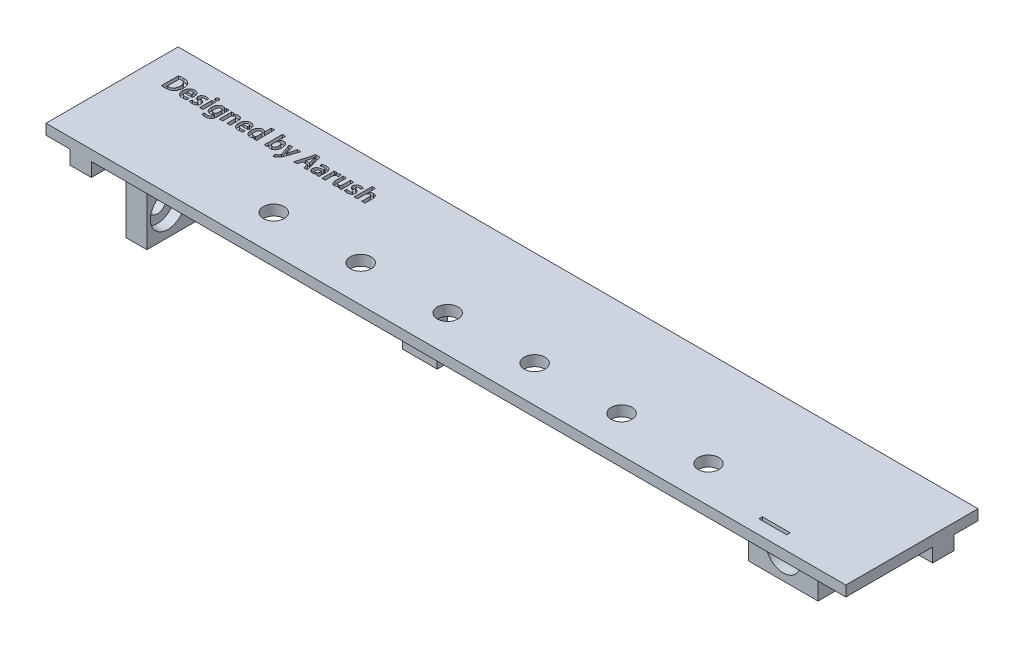
from build123d import *

# Parameters (mm, degrees)
SKETCH_18_W          = 230
SKETCH_18_H          = 36
EXTRUDE_5_DEPTH      = 3
SKETCH_20_W          = 230
SKETCH_20_H          = 2
EXTRUDE_6_DEPTH      = 3
SKETCH_21_W          = 6
SKETCH_21_H          = 18
EXTRUDE_7_DEPTH      = 23
EXTRUDE_8_DEPTH      = 4
EXTRUDE_9_DEPTH      = 4
SKETCH_25_R          = 2.6
CUT_EXTRUDE_12_DEPTH = 6
SKETCH_26_R          = 5
CUT_EXTRUDE_13_DEPTH = 3
SKETCH_29_R          = 3
SKETCH_29_W          = 8
SKETCH_29_H          = 1
CUT_EXTRUDE_14_DEPTH = 17
SKETCH_30_W          = 20
SKETCH_30_H          = 3
EXTRUDE_11_DEPTH     = 20
SKETCH_31_R          = 2.6
CUT_EXTRUDE_15_DEPTH = 20
SKETCH_32_W          = 20
SKETCH_32_H          = 3
CUT_EXTRUDE_16_DEPTH = 20
SKETCH_34_W          = 20
SKETCH_34_H          = 17
SKETCH_34_R          = 5
EXTRUDE_12_DEPTH     = 3
CUT_EXTRUDE_17_DEPTH = 6
SKETCH_36_W          = 10
SKETCH_36_H          = 3
EXTRUDE_13_DEPTH     = 17
CUT_EXTRUDE_18_DEPTH = 17
SKETCH_39_W          = 0.951468829
SKETCH_39_H          = 3.605506115
CUT_EXTRUDE_19_DEPTH = 1


with BuildPart() as part:
    # 草图18 → 凸台-拉伸5 (new body)
    with BuildSketch(Plane(origin=(0, 0, 0), x_dir=(1, 0, 0), z_dir=(0, 1, 0))):
        with Locations((115, 18)):
            Rectangle(SKETCH_18_W, SKETCH_18_H)
    extrude(amount=EXTRUDE_5_DEPTH)

    # 草图20 → 凸台-拉伸6 (add)
    with BuildSketch(Plane(origin=(0, 3, 0), x_dir=(1, 0, 0), z_dir=(0, 1, 0))):
        with Locations((115, -1)):
            Rectangle(SKETCH_20_W, SKETCH_20_H)
    extrude(amount=-EXTRUDE_6_DEPTH)

    # 草图21 → 凸台-拉伸7 (add)
    with BuildSketch(Plane(origin=(0, 3, 0), x_dir=(1, 0, 0), z_dir=(0, 1, 0))):
        with Locations((23, 7)):
            Rectangle(SKETCH_21_W, SKETCH_21_H)
    extrude(amount=-EXTRUDE_7_DEPTH)

    # 草图23 → 凸台-拉伸8 (add)
    with BuildSketch(Plane.XZ):
        Polygon((6.95, -17), (6.95, -36), (10, -36), (13.05, -36), (13.05, -17), (13.05, 2), (6.95, 2), align=None)
    extrude(amount=EXTRUDE_8_DEPTH)

    # 草图24 → 凸台-拉伸9 (add)
    with BuildSketch(Plane.XZ):
        Polygon((20, -26), (20, -29.05), (230, -29.05), (230, -22.95), (20, -22.95), align=None)
    extrude(amount=EXTRUDE_9_DEPTH)

    # 草图25 → 切除-拉伸12 (cut)
    with BuildSketch(Plane(origin=(26, 0, 0), x_dir=(0, 0, -1), z_dir=(1, 0, 0))):
        with Locations((7, -10)):
            Circle(SKETCH_25_R)
    extrude(amount=-CUT_EXTRUDE_12_DEPTH, mode=Mode.SUBTRACT)

    # 草图26 → 切除-拉伸13 (cut)
    with BuildSketch(Plane(origin=(26, 0, 0), x_dir=(0, 0, -1), z_dir=(1, 0, 0))):
        with Locations((7, -10)):
            Circle(SKETCH_26_R)
    extrude(amount=-CUT_EXTRUDE_13_DEPTH, mode=Mode.SUBTRACT)

    # 草图29 → 切除-拉伸14 (cut)
    with BuildSketch(Plane.XZ):
        with Locations((55, -8.5)):
            Circle(SKETCH_29_R)
        with Locations((80, -8.5)):
            Circle(SKETCH_29_R)
        with Locations((105, -8.5)):
            Circle(SKETCH_29_R)
        with Locations((130, -8.5)):
            Circle(SKETCH_29_R)
        with Locations((155, -8.5)):
            Circle(SKETCH_29_R)
        with Locations((180, -8.5)):
            Circle(SKETCH_29_R)
        with Locations((205, -2.5)):
            Rectangle(SKETCH_29_W, SKETCH_29_H)
    extrude(amount=-CUT_EXTRUDE_14_DEPTH, mode=Mode.SUBTRACT)

    # 草图30 → 凸台-拉伸11 (add)
    with BuildSketch(Plane.XZ):
        with Locations((200, -14.5)):
            Rectangle(SKETCH_30_W, SKETCH_30_H)
    extrude(amount=EXTRUDE_11_DEPTH)

    # 草图31 → 切除-拉伸15 (cut)
    with BuildSketch(Plane.XY.offset(-13)):
        with Locations((200, -10)):
            Circle(SKETCH_31_R)
    extrude(amount=-CUT_EXTRUDE_15_DEPTH, mode=Mode.SUBTRACT)

    # 草图32 → 切除-拉伸16 (cut)
    with BuildSketch(Plane.XY.offset(-13)):
        with Locations((200, -18.5)):
            Rectangle(SKETCH_32_W, SKETCH_32_H)
    extrude(amount=-CUT_EXTRUDE_16_DEPTH, mode=Mode.SUBTRACT)

    # 草图34 → 凸台-拉伸12 (add)
    with BuildSketch(Plane.XY.offset(-13)):
        with Locations((200, -8.5)):
            Rectangle(SKETCH_34_W, SKETCH_34_H)
        with Locations((200, -10)):
            Circle(SKETCH_34_R, mode=Mode.SUBTRACT)
    extrude(amount=EXTRUDE_12_DEPTH)

    # 草图35 → 切除-拉伸17 (cut)
    with BuildSketch(Plane(origin=(26, 0, 0), x_dir=(0, 0, -1), z_dir=(1, 0, 0))):
        Polygon((-2, -20), (16, -20), (16, -17), (1, -17), (1, 0), (-2, 0), align=None)
    extrude(amount=-CUT_EXTRUDE_17_DEPTH, mode=Mode.SUBTRACT)

    # 草图36 → 凸台-拉伸13 (add)
    with BuildSketch(Plane.XZ):
        with Locations((92.5, -14.5)):
            Rectangle(SKETCH_36_W, SKETCH_36_H)
    extrude(amount=EXTRUDE_13_DEPTH)

    # 草图37 → 切除-拉伸18 (cut)
    with BuildSketch(Plane.XY.offset(-13)):
        with BuildLine():
            ThreePointArc((92.5, -7.4), (90.661522369, -11.838477631), (95.1, -10))
            ThreePointArc((95.1, -10), (94.338477631, -8.161522369), (92.5, -7.4))
        make_face()
    extrude(amount=-CUT_EXTRUDE_18_DEPTH, mode=Mode.SUBTRACT)

    # 草图39 → 切除-拉伸19 (cut)
    # profile 1 of 17: a face of its own
    with BuildSketch(Plane(origin=(0, 3, 0), x_dir=(1, 0, 0), z_dir=(0, 1, 0))):
        with BuildLine():
            add(Edge.make_bspline(
                [(7.223367197, 23.976072351), (7.256748347, 23.971446491), (7.327145451, 23.961691069), (7.437694714, 23.949767465), (7.558256306, 23.939740367), (7.688404522, 23.930122816), (7.828288901, 23.922887272), (7.977827616, 23.917202477), (8.136742689, 23.913752838), (8.246008031, 23.912045685), (8.302197873, 23.91116778)],
                knots=[0, 0, 0, 0, 0.747798485, 1.577023202, 2.466955376, 3.432305679, 4.472841868, 5.575028817, 6.752955478, 8, 8, 8, 8], degree=3))
            add(Edge.make_bspline(
                [(8.302197873, 23.91116778), (8.406838769, 23.9128704), (8.610896208, 23.916190635), (8.907874632, 23.944689318), (9.187653788, 23.990762154), (9.448966059, 24.057048969), (9.6920365, 24.141404291), (9.914058247, 24.24736803), (10.11812863, 24.369408625), (10.23723221, 24.469555009), (10.295972666, 24.518946004)],
                knots=[0, 0, 0, 0, 1.17842423, 2.298013867, 3.356996017, 4.369259479, 5.331192529, 6.249700563, 7.136773321, 8, 8, 8, 8], degree=3))
            add(Edge.make_bspline(
                [(10.295972666, 24.518946004), (10.32057397, 24.541150628), (10.370581068, 24.58628599), (10.442294214, 24.660477579), (10.509825377, 24.743450779), (10.577399191, 24.832045389), (10.638912049, 24.930437516), (10.701790946, 25.034122135), (10.759931613, 25.146523138), (10.81677499, 25.266055727), (10.869838594, 25.393943937), (10.913872997, 25.532420213), (10.953902301, 25.679351648), (10.984703838, 25.836315417), (11.011758106, 26.002345387), (11.029211739, 26.178152791), (11.043387989, 26.363290997), (11.045797009, 26.489903449), (11.047032968, 26.554862585)],
                knots=[0, 0, 0, 0, 0.711529635, 1.446327024, 2.212730038, 3.007707617, 3.836959069, 4.702581573, 5.611055214, 6.552559085, 7.54462654, 8.581167827, 9.670545423, 10.812911411, 12.014096724, 13.281372547, 14.605194915, 16, 16, 16, 16], degree=3))
            add(Edge.make_bspline(
                [(11.047032968, 26.554862585), (11.046185459, 26.610126334), (11.044527537, 26.718234837), (11.035300727, 26.877309781), (11.019083523, 27.03002387), (10.998251503, 27.176749582), (10.96968847, 27.316952487), (10.936200537, 27.450774554), (10.897175832, 27.578576113), (10.850944521, 27.699716786), (10.799280947, 27.814886729), (10.743313425, 27.924970329), (10.681224092, 28.028829134), (10.61478193, 28.127663783), (10.542833338, 28.220316296), (10.465227019, 28.306629673), (10.384192662, 28.388928569), (10.325402578, 28.438568107), (10.295972666, 28.463417319)],
                knots=[0, 0, 0, 0, 1.250196122, 2.445668869, 3.60292861, 4.723409941, 5.796680955, 6.837975795, 7.843086112, 8.817515314, 9.76895262, 10.69744629, 11.609358382, 12.504409608, 13.39005195, 14.260302496, 15.129119398, 16, 16, 16, 16], degree=3))
            add(Edge.make_bspline(
                [(10.295972666, 28.463417319), (10.243164639, 28.50554366), (10.136446203, 28.590675741), (9.957513959, 28.697267434), (9.762609515, 28.78693316), (9.550892686, 28.861771642), (9.319899763, 28.918092083), (9.068229702, 28.959215269), (8.794939146, 28.983117633), (8.60535421, 28.986235618), (8.507287905, 28.987848453)],
                knots=[0, 0, 0, 0, 0.850789701, 1.719339872, 2.61723906, 3.551911928, 4.545442216, 5.610282156, 6.763874371, 8, 8, 8, 8], degree=3))
            add(Edge.make_bspline(
                [(8.507287905, 28.987848453), (8.388942811, 28.986780803), (8.157994983, 28.984697308), (7.873933039, 28.966398951), (7.657622664, 28.946978857), (7.505719671, 28.927522168), (7.361305991, 28.907655435), (7.267960951, 28.891057781), (7.222431627, 28.882962226)],
                knots=[0, 0, 0, 0, 1.650018419, 3.219974348, 3.967566001, 4.678084243, 5.355231624, 6, 6, 6, 6], degree=3))
            Line((7.222431627, 28.882962226), (7.223367197, 23.976072351))
        make_face()
        with BuildLine():
            add(Edge.make_bspline(
                [(8.174836026, 28.189523136), (8.203189957, 28.194717989), (8.265533517, 28.206140237), (8.368851518, 28.216161521), (8.48965884, 28.225204857), (8.576252994, 28.226651249), (8.622475458, 28.227423309)],
                knots=[0, 0, 0, 0, 0.76869223, 1.690171609, 2.76705349, 4, 4, 4, 4], degree=3))
            add(Edge.make_bspline(
                [(8.622475458, 28.227423309), (8.676537356, 28.226221806), (8.781915191, 28.223879828), (8.935331769, 28.204023035), (9.079353383, 28.170817843), (9.215365319, 28.127174184), (9.340558147, 28.06536848), (9.458401115, 27.994141853), (9.565870771, 27.907437786), (9.664713441, 27.809018491), (9.753340588, 27.696691501), (9.830377393, 27.570627427), (9.894180666, 27.43084795), (9.949909441, 27.279160575), (9.989250543, 27.112925567), (10.020788686, 26.934488534), (10.039196079, 26.742532605), (10.042401945, 26.610152805), (10.044058425, 26.541751807)],
                knots=[0, 0, 0, 0, 1.034636826, 2.016721417, 2.954616098, 3.861659027, 4.743652532, 5.62095741, 6.492606741, 7.379948462, 8.28614458, 9.224914536, 10.200706863, 11.223314941, 12.31319917, 13.465574242, 14.690455408, 16, 16, 16, 16], degree=3))
            add(Edge.make_bspline(
                [(10.044058425, 26.541751807), (10.04217686, 26.463044496), (10.038541542, 26.310976298), (10.018182173, 26.090942912), (9.984403575, 25.887660279), (9.940315283, 25.699963971), (9.882302985, 25.529042894), (9.81221156, 25.373852566), (9.72871609, 25.235640235), (9.633317927, 25.113408387), (9.527064642, 25.007465319), (9.411936758, 24.915973513), (9.288549828, 24.838210692), (9.155259321, 24.776308695), (9.013510308, 24.728779593), (8.863305348, 24.69472636), (8.704127729, 24.67596875), (8.595053686, 24.674933287), (8.539128367, 24.674402376)],
                knots=[0, 0, 0, 0, 1.382790342, 2.671650606, 3.877892401, 5.000458499, 6.054825918, 7.043745429, 7.986092149, 8.88452668, 9.760866288, 10.615577842, 11.46308158, 12.316807429, 13.190810493, 14.084799087, 15.018022824, 16, 16, 16, 16], degree=3))
            add(Edge.make_bspline(
                [(8.539128367, 24.674402376), (8.505721853, 24.673688903), (8.441070696, 24.672308129), (8.347077545, 24.676860449), (8.258874531, 24.682582834), (8.202273873, 24.690318559), (8.174836026, 24.694068544)],
                knots=[0, 0, 0, 0, 1.0974001, 2.123783006, 3.090481336, 4, 4, 4, 4], degree=3))
            Line((8.174836026, 24.694068544), (8.174836026, 28.189523136))
        make_face(mode=Mode.SUBTRACT)
    # profile 2 of 17: a face of its own
    with BuildSketch(Plane(origin=(0, 3, 0), x_dir=(1, 0, 0), z_dir=(0, 1, 0))):
        with BuildLine():
            add(Edge.make_bspline(
                [(14.619560939, 25.465730583), (14.623612099, 25.492857246), (14.632109763, 25.549757809), (14.64019945, 25.639464219), (14.644925116, 25.736634352), (14.644977903, 25.803796478), (14.645005141, 25.838452197)],
                knots=[0, 0, 0, 0, 0.879814102, 1.845487553, 2.888269607, 4, 4, 4, 4], degree=3))
            add(Edge.make_bspline(
                [(14.645005141, 25.838452197), (14.643451616, 25.909362135), (14.640434221, 26.047089827), (14.620467277, 26.247029185), (14.589319366, 26.433734528), (14.545101064, 26.60685921), (14.490216324, 26.767008691), (14.423009881, 26.913895569), (14.342793176, 27.046773447), (14.251979916, 27.16639696), (14.149922374, 27.27165205), (14.039493032, 27.364509404), (13.918411029, 27.440773552), (13.790213897, 27.506182437), (13.651530819, 27.553789027), (13.504693541, 27.590132358), (13.348532377, 27.610335687), (13.241581408, 27.61339731), (13.186899291, 27.614962663)],
                knots=[0, 0, 0, 0, 1.306657607, 2.537908493, 3.699270234, 4.791739878, 5.826909547, 6.815290999, 7.762398175, 8.68170366, 9.57675071, 10.459137333, 11.333612719, 12.208315133, 13.105301175, 14.028952094, 14.992238463, 16, 16, 16, 16], degree=3))
            add(Edge.make_bspline(
                [(13.186899291, 27.614962663), (13.121856315, 27.61150023), (12.995180005, 27.604756871), (12.811227771, 27.574496924), (12.639244654, 27.527749976), (12.478610711, 27.465155507), (12.330734545, 27.384867078), (12.194476701, 27.288842323), (12.071200965, 27.175235516), (11.960333756, 27.046725014), (11.861283907, 26.906763932), (11.776398106, 26.756872836), (11.702283257, 26.600203644), (11.644044674, 26.434486177), (11.596741504, 26.261829222), (11.563419243, 26.081392847), (11.542224946, 25.893269788), (11.539261228, 25.765151965), (11.537750672, 25.69985254)],
                knots=[0, 0, 0, 0, 1.102218766, 2.14665769, 3.149339139, 4.115122672, 5.058741015, 5.991431174, 6.93040496, 7.889527187, 8.860316271, 9.828598601, 10.80279168, 11.790822775, 12.798603709, 13.831085196, 14.894541863, 16, 16, 16, 16], degree=3))
            add(Edge.make_bspline(
                [(11.537750672, 25.69985254), (11.539047243, 25.632037318), (11.541570283, 25.500073438), (11.565257665, 25.307946994), (11.599831367, 25.126621843), (11.649958072, 24.956595479), (11.711869122, 24.797077066), (11.790895572, 24.650291513), (11.881627171, 24.513476371), (11.98683512, 24.388734594), (12.104997922, 24.276400932), (12.237356288, 24.179828926), (12.381288905, 24.096772043), (12.538291974, 24.029366567), (12.707349323, 23.975873847), (12.889365606, 23.938164969), (13.083520801, 23.913171632), (13.217410747, 23.909372693), (13.286166613, 23.907421843)],
                knots=[0, 0, 0, 0, 1.145056205, 2.228202694, 3.265464393, 4.259985655, 5.218630789, 6.1504322, 7.070355583, 7.987236137, 8.901139799, 9.817656355, 10.748382851, 11.702521477, 12.69814653, 13.738580065, 14.838703788, 16, 16, 16, 16], degree=3))
            add(Edge.make_bspline(
                [(13.286166613, 23.907421843), (13.342996684, 23.908180497), (13.454877246, 23.909674048), (13.620147832, 23.920314758), (13.779863545, 23.936770931), (13.933207617, 23.960402795), (14.079389687, 23.988761651), (14.216139759, 24.024456448), (14.34403386, 24.064264892), (14.424189073, 24.096682853), (14.463327212, 24.112511876)],
                knots=[0, 0, 0, 0, 1.134244074, 2.232970358, 3.304290349, 4.337913843, 5.328893587, 6.274899807, 7.157669119, 8, 8, 8, 8], degree=3))
            Line((14.463327212, 24.112511876), (14.328272294, 24.765548624))
            add(Edge.make_bspline(
                [(14.328272294, 24.765548624), (14.265674432, 24.744058009), (14.135139143, 24.69924364), (13.922427602, 24.657809692), (13.688727991, 24.627938182), (13.525077137, 24.622161669), (13.439750017, 24.61914981)],
                knots=[0, 0, 0, 0, 0.87704573, 1.828902987, 2.867995791, 4, 4, 4, 4], degree=3))
            add(Edge.make_bspline(
                [(13.439750017, 24.61914981), (13.406330512, 24.619299246), (13.340312789, 24.619594446), (13.243293231, 24.628226355), (13.15023343, 24.642865618), (13.061580639, 24.665091959), (12.975920964, 24.691511051), (12.894799352, 24.726565259), (12.817290737, 24.766974946), (12.74406413, 24.81359026), (12.676353386, 24.867440518), (12.617029394, 24.930179911), (12.564649342, 24.99983597), (12.522277533, 25.078233473), (12.485585702, 25.163491202), (12.459644413, 25.257192404), (12.439055295, 25.358219632), (12.433230356, 25.428483392), (12.430220084, 25.464795014)],
                knots=[0, 0, 0, 0, 1.08234867, 2.138098532, 3.15234098, 4.131067708, 5.097013137, 6.053166887, 6.989593978, 7.926621641, 8.861682363, 9.784465562, 10.716952089, 11.676682853, 12.664718862, 13.717752465, 14.820556852, 16, 16, 16, 16], degree=3))
            Line((12.430220084, 25.464795014), (14.619560939, 25.465730583))
        make_face()
        with BuildLine():
            add(Edge.make_bspline(
                [(12.430220084, 26.117524479), (12.43496982, 26.165463051), (12.444516514, 26.261816808), (12.480578633, 26.404164431), (12.537470304, 26.542680491), (12.596780154, 26.654873195), (12.653861823, 26.739604514), (12.704290565, 26.795636366), (12.760547139, 26.843720144), (12.823020979, 26.882961393), (12.890417501, 26.915517593), (12.964127874, 26.939562868), (13.043530334, 26.956788674), (13.098782842, 26.961014371), (13.126964305, 26.963169682)],
                knots=[0, 0, 0, 0, 1.434019087, 2.882295425, 4.35559367, 5.887023456, 6.655881304, 7.39355732, 8.125995891, 8.853635031, 9.585837332, 10.350577125, 11.158714241, 12, 12, 12, 12], degree=3))
            add(Edge.make_bspline(
                [(13.126964305, 26.963169682), (13.155741051, 26.960861733), (13.211443402, 26.956394301), (13.291695532, 26.94166422), (13.36532175, 26.918626852), (13.431218912, 26.886029915), (13.491501238, 26.847717893), (13.544032097, 26.800142993), (13.590592269, 26.745676928), (13.640759261, 26.66232684), (13.690119321, 26.550783355), (13.734781526, 26.41130909), (13.757125312, 26.265608403), (13.757809196, 26.167221066), (13.758154634, 26.117524479)],
                knots=[0, 0, 0, 0, 0.873766243, 1.691325154, 2.465551819, 3.201135629, 3.9116346, 4.62125276, 5.338946048, 6.073375047, 7.558144449, 9.023104326, 10.496335382, 12, 12, 12, 12], degree=3))
            Line((13.758154634, 26.117524479), (12.430220084, 26.117524479))
        make_face(mode=Mode.SUBTRACT)
    # profile 3 of 17: a face of its own
    with BuildSketch(Plane(origin=(0, 3, 0), x_dir=(1, 0, 0), z_dir=(0, 1, 0))):
        with BuildLine():
            add(Edge.make_bspline(
                [(15.11057038, 24.155251769), (15.141988733, 24.136819462), (15.206857576, 24.098762649), (15.314398824, 24.054881723), (15.430218706, 24.012558639), (15.55561705, 23.978057821), (15.688016998, 23.948689296), (15.825720078, 23.928402427), (15.96772105, 23.916070931), (16.063753755, 23.914060658), (16.112475831, 23.913040748)],
                knots=[0, 0, 0, 0, 0.83761196, 1.729400559, 2.668252281, 3.676193025, 4.720774259, 5.789020092, 6.87826204, 8, 8, 8, 8], degree=3))
            add(Edge.make_bspline(
                [(16.112475831, 23.913040748), (16.167769323, 23.914494836), (16.275150493, 23.917318706), (16.431274655, 23.933520059), (16.577513455, 23.95837594), (16.713865645, 23.992829907), (16.840197072, 24.036964628), (16.956786403, 24.090146826), (17.06334012, 24.15307375), (17.159389952, 24.225457699), (17.244164641, 24.306104744), (17.31959158, 24.392417324), (17.381219546, 24.487263252), (17.433277888, 24.587756144), (17.473819974, 24.69556559), (17.502394721, 24.809953411), (17.520815896, 24.931037311), (17.523379463, 25.013965616), (17.524693956, 25.056487917)],
                knots=[0, 0, 0, 0, 1.294448016, 2.513846346, 3.670773034, 4.764320961, 5.802019244, 6.79930617, 7.759297293, 8.693207164, 9.608170021, 10.494314425, 11.369880064, 12.249036721, 13.139389433, 14.05924175, 15.004857203, 16, 16, 16, 16], degree=3))
            add(Edge.make_bspline(
                [(17.524693956, 25.056487917), (17.524615641, 25.086476747), (17.524461847, 25.145367876), (17.514841641, 25.232557091), (17.497385655, 25.316495458), (17.476095799, 25.398666021), (17.443671792, 25.476446536), (17.408094341, 25.55272563), (17.363407111, 25.625271647), (17.311341732, 25.694552946), (17.253680609, 25.762039944), (17.188404537, 25.826125213), (17.116097127, 25.88674301), (17.037127443, 25.945170558), (16.950834337, 26.000079997), (16.857768294, 26.052753851), (16.757645256, 26.102297268), (16.687627982, 26.132219481), (16.651890712, 26.147491972)],
                knots=[0, 0, 0, 0, 0.962486949, 1.890101854, 2.810103424, 3.714741646, 4.610057768, 5.511190598, 6.415440003, 7.339636668, 8.292049338, 9.263110372, 10.273172223, 11.319680428, 12.415205866, 13.555314351, 14.752216631, 16, 16, 16, 16], degree=3))
            add(Edge.make_bspline(
                [(16.651890712, 26.147491972), (16.603023193, 26.167685201), (16.51260423, 26.205048482), (16.389475001, 26.262771611), (16.29046474, 26.318758221), (16.211103243, 26.370757391), (16.153187021, 26.427022508), (16.112126537, 26.487103577), (16.08816505, 26.553744549), (16.086894615, 26.599941265), (16.086254275, 26.623225929)],
                knots=[0, 0, 0, 0, 1.614286799, 2.986894832, 4.147698299, 5.086165248, 5.874638583, 6.596229827, 7.29245366, 8, 8, 8, 8], degree=3))
            add(Edge.make_bspline(
                [(16.086254275, 26.623225929), (16.087720853, 26.646796282), (16.090601646, 26.693095406), (16.112651462, 26.759293007), (16.15072201, 26.817984158), (16.202991254, 26.869081932), (16.269933614, 26.910167632), (16.349890541, 26.941697947), (16.443972628, 26.958211349), (16.510739267, 26.961453918), (16.546068001, 26.963169682)],
                knots=[0, 0, 0, 0, 0.881322943, 1.731178161, 2.577168917, 3.477799905, 4.443891127, 5.498430146, 6.676325488, 8, 8, 8, 8], degree=3))
            add(Edge.make_bspline(
                [(16.546068001, 26.963169682), (16.579483145, 26.961624768), (16.645540767, 26.958570663), (16.742608952, 26.948406074), (16.835179707, 26.927456905), (16.923598609, 26.90308091), (17.005825539, 26.8720678), (17.082796033, 26.843327527), (17.15161701, 26.811030093), (17.194216822, 26.787927366), (17.214717697, 26.776809333)],
                knots=[0, 0, 0, 0, 1.145139439, 2.263799542, 3.334746207, 4.390066399, 5.400675127, 6.341237668, 7.2017317, 8, 8, 8, 8], degree=3))
            Line((17.214717697, 26.776809333), (17.391908915, 27.425304499))
            add(Edge.make_bspline(
                [(17.391908915, 27.425304499), (17.364823881, 27.438259118), (17.30865859, 27.46512266), (17.21836056, 27.500843962), (17.118912704, 27.531966738), (17.011743632, 27.561450481), (16.896632323, 27.584745769), (16.774288168, 27.601071163), (16.645567026, 27.613032128), (16.557334787, 27.614310803), (16.512354571, 27.614962663)],
                knots=[0, 0, 0, 0, 0.793782206, 1.646038456, 2.564925853, 3.548079898, 4.584144923, 5.667469512, 6.810891258, 8, 8, 8, 8], degree=3))
            add(Edge.make_bspline(
                [(16.512354571, 27.614962663), (16.462665464, 27.613593814), (16.365499225, 27.610917052), (16.224136684, 27.593283845), (16.091045095, 27.568497102), (15.965821561, 27.534768242), (15.849028441, 27.491127921), (15.74073467, 27.437310201), (15.640514167, 27.375147557), (15.548972698, 27.304423024), (15.467495772, 27.225480097), (15.395844364, 27.140856252), (15.334409268, 27.050709776), (15.284466705, 26.95407939), (15.245052746, 26.852047409), (15.21702187, 26.74393744), (15.198947845, 26.630678362), (15.195523164, 26.55305658), (15.193784863, 26.513657282)],
                knots=[0, 0, 0, 0, 1.238305518, 2.421486237, 3.5461187, 4.61066152, 5.649707088, 6.648348897, 7.619889882, 8.584803378, 9.525735187, 10.442256057, 11.344296488, 12.23865353, 13.147513515, 14.064694656, 15.017676866, 16, 16, 16, 16], degree=3))
            add(Edge.make_bspline(
                [(15.193784863, 26.513657282), (15.195646035, 26.464402184), (15.199365034, 26.365980474), (15.23945965, 26.220398923), (15.304857852, 26.07923219), (15.380619173, 25.966508365), (15.454809521, 25.879572585), (15.52145897, 25.815984951), (15.595105846, 25.752694093), (15.679506841, 25.693142497), (15.771505265, 25.634353032), (15.872611429, 25.57799841), (15.9822766, 25.523534324), (16.059550427, 25.490331051), (16.099365053, 25.473223371)],
                knots=[0, 0, 0, 0, 1.205031059, 2.40789731, 3.671482689, 5.006580914, 5.722947508, 6.46981472, 7.262559811, 8.101501413, 8.999551731, 9.938382947, 10.93777087, 12, 12, 12, 12], degree=3))
            add(Edge.make_bspline(
                [(16.099365053, 25.473223371), (16.145816208, 25.454134727), (16.232303284, 25.418593716), (16.348982287, 25.360796374), (16.443439726, 25.304133838), (16.517859685, 25.247803069), (16.571377842, 25.186568955), (16.609812681, 25.12125906), (16.630987907, 25.048740634), (16.631808859, 24.998553069), (16.632224544, 24.973140826)],
                knots=[0, 0, 0, 0, 1.539706787, 2.866769117, 3.98803217, 4.914911995, 5.715441686, 6.465811877, 7.223170887, 8, 8, 8, 8], degree=3))
            add(Edge.make_bspline(
                [(16.632224544, 24.973140826), (16.63100979, 24.946723553), (16.628670562, 24.89585236), (16.604012646, 24.823552498), (16.562758975, 24.76089237), (16.505737917, 24.706893292), (16.431978189, 24.664676976), (16.341815314, 24.635467718), (16.235915689, 24.616756668), (16.159702236, 24.614653339), (16.119031221, 24.613530905)],
                knots=[0, 0, 0, 0, 0.894036243, 1.721627017, 2.5562417, 3.418119501, 4.363067525, 5.415159204, 6.6206097, 8, 8, 8, 8], degree=3))
            add(Edge.make_bspline(
                [(16.119031221, 24.613530905), (16.080897, 24.615104343), (16.004674553, 24.618249321), (15.890503815, 24.634067256), (15.776067449, 24.656945698), (15.66395566, 24.69007137), (15.55680105, 24.726760212), (15.458572882, 24.766302431), (15.369814949, 24.805782847), (15.31595398, 24.836024937), (15.290242732, 24.8504614)],
                knots=[0, 0, 0, 0, 1.051998463, 2.102728099, 3.174823593, 4.267460494, 5.323782618, 6.297336217, 7.187210868, 8, 8, 8, 8], degree=3))
            Line((15.290242732, 24.8504614), (15.11057038, 24.155251769))
        make_face()
    # profile 4 of 17: a face of its own
    with BuildSketch(Plane(origin=(0, 3, 0), x_dir=(1, 0, 0), z_dir=(0, 1, 0))):
        with BuildLine():
            add(Edge.make_bspline(
                [(19.175304003, 28.548599882), (19.172870154, 28.584352636), (19.16816991, 28.653398249), (19.142067211, 28.751872181), (19.097156519, 28.838989463), (19.03536389, 28.913382592), (18.960156052, 28.975213081), (18.870865252, 29.019623442), (18.769647996, 29.047368331), (18.697983081, 29.051335597), (18.660649252, 29.053402345)],
                knots=[0, 0, 0, 0, 1.0628526, 2.052577784, 3.002270958, 3.950877112, 4.906661741, 5.872869434, 6.891871596, 8, 8, 8, 8], degree=3))
            add(Edge.make_bspline(
                [(18.660649252, 29.053402345), (18.624555079, 29.051333381), (18.555028759, 29.047348044), (18.456412875, 29.019267387), (18.368477422, 28.974955469), (18.293363868, 28.91343408), (18.231731177, 28.838751216), (18.185849975, 28.751994576), (18.158300024, 28.653269589), (18.154244006, 28.583777366), (18.152138349, 28.547700894)],
                knots=[0, 0, 0, 0, 1.078872945, 2.078176622, 3.042978182, 4.005607781, 4.961007496, 5.921823378, 6.921127055, 8, 8, 8, 8], degree=3))
            add(Edge.make_bspline(
                [(18.152138349, 28.547700894), (18.15423974, 28.512541074), (18.158321218, 28.444251075), (18.186419785, 28.347386477), (18.229831947, 28.260110171), (18.29055783, 28.184556783), (18.36565091, 28.122492529), (18.453598405, 28.076619207), (18.553571791, 28.049224553), (18.623953556, 28.044475505), (18.660649252, 28.041999443)],
                knots=[0, 0, 0, 0, 1.051693418, 2.042676611, 2.99556181, 3.952972936, 4.922169701, 5.89190696, 6.900880919, 8, 8, 8, 8], degree=3))
            add(Edge.make_bspline(
                [(18.660649252, 28.041999443), (18.696709796, 28.043810271), (18.766415891, 28.047310653), (18.865601424, 28.073891579), (18.953513663, 28.118294956), (19.031264615, 28.176773902), (19.093038847, 28.252084935), (19.140811627, 28.338926869), (19.167396256, 28.439781552), (19.172249324, 28.510722063), (19.17477906, 28.547700894)],
                knots=[0, 0, 0, 0, 1.069775721, 2.067908052, 3.021147403, 3.979463785, 4.933468663, 5.891292003, 6.900803572, 8, 8, 8, 8], degree=3))
            Line((19.17477906, 28.547700894), (19.175304003, 28.548599882))
        make_face()
    # profile 5 of 17: a face of its own
    with BuildSketch(Plane(origin=(0, 3, 0), x_dir=(1, 0, 0), z_dir=(0, 1, 0))):
        with Locations((18.667204184, 25.767646129)):
            Rectangle(SKETCH_39_W, SKETCH_39_H)
    # profile 6 of 17: a face of its own
    with BuildSketch(Plane(origin=(0, 3, 0), x_dir=(1, 0, 0), z_dir=(0, 1, 0))):
        with BuildLine():
            Line((22.202917992, 27.158893044), (22.190059626, 27.158893044))
            add(Edge.make_bspline(
                [(22.190059626, 27.158893044), (22.16842944, 27.194378019), (22.125189224, 27.265314902), (22.045884564, 27.362857051), (21.95223414, 27.448875893), (21.846837093, 27.52573698), (21.727359756, 27.589418271), (21.592124753, 27.633843733), (21.443163628, 27.662248145), (21.338816928, 27.666877078), (21.28467789, 27.669278745)],
                knots=[0, 0, 0, 0, 0.91194406, 1.823038364, 2.74947634, 3.696978115, 4.681283312, 5.708799609, 6.811238071, 8, 8, 8, 8], degree=3))
            add(Edge.make_bspline(
                [(21.28467789, 27.669278745), (21.234633481, 27.667248495), (21.135834797, 27.663240336), (20.990638762, 27.638305301), (20.851273047, 27.598231514), (20.71835802, 27.541167611), (20.590989089, 27.469589395), (20.469645981, 27.382034638), (20.355350117, 27.277879983), (20.246764395, 27.160356919), (20.147105059, 27.028159593), (20.060281845, 26.881644906), (19.985897981, 26.722324258), (19.925181756, 26.549662867), (19.876982599, 26.364128593), (19.840430716, 26.1657533), (19.817097267, 25.954465763), (19.811602452, 25.809166912), (19.808778841, 25.734502454)],
                knots=[0, 0, 0, 0, 0.885373344, 1.747921968, 2.599097469, 3.445385455, 4.300992889, 5.179275523, 6.086496419, 7.032364824, 8.006588637, 9.009628343, 10.039924269, 11.112458542, 12.243056895, 13.428107705, 14.678386356, 16, 16, 16, 16], degree=3))
            add(Edge.make_bspline(
                [(19.808778841, 25.734502454), (19.810433581, 25.671400352), (19.813668413, 25.548042727), (19.832592304, 25.367769422), (19.862797159, 25.196736614), (19.902286239, 25.033820908), (19.955484371, 24.880139628), (20.017465667, 24.734031403), (20.093105451, 24.598191383), (20.177958193, 24.471377965), (20.272897607, 24.356395852), (20.377403316, 24.254994815), (20.49127285, 24.169580285), (20.613514084, 24.098558871), (20.744320456, 24.041557815), (20.884697623, 24.002378105), (21.032991794, 23.974889572), (21.135025499, 23.969908141), (21.187283536, 23.96735683)],
                knots=[0, 0, 0, 0, 1.208362038, 2.362214062, 3.466770768, 4.532308077, 5.568159598, 6.577492553, 7.567363776, 8.5405086, 9.495625002, 10.417177268, 11.322141959, 12.214063151, 13.119008102, 14.045972215, 14.999216425, 16, 16, 16, 16], degree=3))
            add(Edge.make_bspline(
                [(21.187283536, 23.96735683), (21.235753092, 23.969121734), (21.330412777, 23.972568544), (21.468204295, 23.995215315), (21.597312381, 24.032921194), (21.717887628, 24.084093719), (21.827530547, 24.150186455), (21.92657062, 24.227180111), (22.014497563, 24.315928344), (22.062247103, 24.383670234), (22.086308337, 24.417805714)],
                knots=[0, 0, 0, 0, 1.109054001, 2.165951419, 3.185422641, 4.180579859, 5.154488301, 6.106137884, 7.045673328, 8, 8, 8, 8], degree=3))
            Line((22.086308337, 24.417805714), (22.10005106, 24.418569351))
            Line((22.10005106, 24.418569351), (22.10005106, 24.158010008))
            add(Edge.make_bspline(
                [(22.10005106, 24.158010008), (22.098935282, 24.116892272), (22.096787588, 24.037747218), (22.083074252, 23.923403639), (22.0637, 23.817598714), (22.03814766, 23.719364736), (22.003309639, 23.630415095), (21.961816264, 23.549575037), (21.913111642, 23.476979292), (21.856607679, 23.412877559), (21.793334142, 23.357790599), (21.725479382, 23.309362727), (21.651891363, 23.268974735), (21.573016538, 23.236217169), (21.488823884, 23.211104439), (21.399680645, 23.191979837), (21.304892538, 23.181925192), (21.240059966, 23.181120889), (21.206949704, 23.180710129)],
                knots=[0, 0, 0, 0, 1.306676293, 2.51514254, 3.655426159, 4.723965388, 5.735434984, 6.685017955, 7.606829933, 8.506540927, 9.392249069, 10.267617308, 11.151267149, 12.054090677, 12.976809819, 13.939978064, 14.94793831, 16, 16, 16, 16], degree=3))
            add(Edge.make_bspline(
                [(21.206949704, 23.180710129), (21.15976941, 23.181896384), (21.067698726, 23.184211321), (20.932689216, 23.199191833), (20.803830064, 23.219599073), (20.68234153, 23.250559198), (20.568430838, 23.284536611), (20.464025755, 23.323196282), (20.368498053, 23.362833749), (20.309914926, 23.393505393), (20.281703346, 23.408275781)],
                knots=[0, 0, 0, 0, 1.176961301, 2.296798561, 3.386409251, 4.429111056, 5.422020005, 6.350919646, 7.205860717, 8, 8, 8, 8], degree=3))
            Line((20.281703346, 23.408275781), (20.097113537, 22.704151261))
            add(Edge.make_bspline(
                [(20.097113537, 22.704151261), (20.134311943, 22.685357799), (20.210960678, 22.646633153), (20.33475892, 22.599776397), (20.468457486, 22.559528434), (20.610804314, 22.526311942), (20.759604699, 22.500087738), (20.91290355, 22.48297134), (21.068786416, 22.47104442), (21.173837798, 22.469671779), (21.226615871, 22.468982161)],
                knots=[0, 0, 0, 0, 0.858428024, 1.768823687, 2.723340394, 3.734538731, 4.779533789, 5.835286231, 6.912442482, 8, 8, 8, 8], degree=3))
            add(Edge.make_bspline(
                [(21.226615871, 22.468982161), (21.277831939, 22.471761071), (21.37789969, 22.477190603), (21.524200685, 22.490900692), (21.663041557, 22.511182311), (21.794767945, 22.533833741), (21.9187945, 22.562168898), (22.035402477, 22.594375812), (22.143804533, 22.633365207), (22.245820149, 22.674718303), (22.339274508, 22.723385793), (22.427121117, 22.773830306), (22.505534725, 22.831761696), (22.577850537, 22.892487536), (22.641430042, 22.959664536), (22.698670284, 23.030380961), (22.748294865, 23.106169044), (22.801257156, 23.213305671), (22.858633843, 23.34835335), (22.916794467, 23.509904159), (22.964825499, 23.668642603), (23.002851506, 23.824485935), (23.02793491, 23.978277349), (23.043245733, 24.129306241), (23.047680466, 24.278078788), (23.041050624, 24.375999588), (23.037776252, 24.424361103)],
                knots=[0, 0, 0, 0, 1.197629168, 2.339969939, 3.429559251, 4.47334925, 5.460043953, 6.399204369, 7.295998093, 8.148820332, 8.967049884, 9.754607797, 10.511304072, 11.240248413, 11.9568431, 12.667182451, 13.362669071, 14.066810699, 15.454609987, 16.787296037, 18.074019785, 19.325726776, 20.530036158, 21.709358677, 22.86868892, 24, 24, 24, 24], degree=3))
            Line((23.037776252, 24.424361103), (23.038711821, 26.498064454))
            add(Edge.make_bspline(
                [(23.038711821, 26.498064454), (23.03854901, 26.558515376), (23.038235694, 26.674847365), (23.040390327, 26.842058978), (23.043041882, 26.994712977), (23.046840409, 27.133628574), (23.051382259, 27.261005047), (23.057426254, 27.37865491), (23.062259667, 27.487691083), (23.067862712, 27.557225053), (23.070553198, 27.590614075)],
                knots=[0, 0, 0, 0, 1.327017148, 2.55371695, 3.670887056, 4.678598558, 5.604339757, 6.46875127, 7.264720581, 8, 8, 8, 8], degree=3))
            Line((23.070553198, 27.590614075), (22.241493092, 27.59154873))
            Line((22.241493092, 27.59154873), (22.202917992, 27.158893044))
        make_face()
        with BuildLine():
            add(Edge.make_bspline(
                [(22.087243907, 25.449163776), (22.084647549, 25.412538112), (22.079650656, 25.342049169), (22.069062684, 25.240767512), (22.04819288, 25.149450053), (22.025356904, 25.066587828), (21.993381305, 24.994057613), (21.958667004, 24.928943271), (21.915084308, 24.874581942), (21.851983265, 24.815828644), (21.769314301, 24.76017366), (21.671272273, 24.708964492), (21.573767001, 24.680805099), (21.509587705, 24.679645803), (21.478530113, 24.679084797)],
                knots=[0, 0, 0, 0, 1.200653339, 2.310750815, 3.323569718, 4.259987666, 5.114897603, 5.909841481, 6.665288414, 7.380003895, 8.721837364, 9.908431039, 10.987849675, 12, 12, 12, 12], degree=3))
            add(Edge.make_bspline(
                [(21.478530113, 24.679084797), (21.450674084, 24.680605183), (21.396443136, 24.683565116), (21.317886991, 24.699040487), (21.244033475, 24.722223946), (21.174985684, 24.755349738), (21.111082769, 24.798008087), (21.051410702, 24.849031681), (20.997128325, 24.909240055), (20.948337752, 24.978364726), (20.904924083, 25.054787001), (20.86627988, 25.137305082), (20.834254076, 25.226395986), (20.808922893, 25.321521087), (20.786516387, 25.422560202), (20.772034206, 25.529991867), (20.763911415, 25.643539802), (20.762106507, 25.721066614), (20.76118324, 25.760724011)],
                knots=[0, 0, 0, 0, 0.922461555, 1.795875721, 2.642221847, 3.478734151, 4.321287252, 5.178662787, 6.071122311, 6.997222554, 7.973824942, 8.976960891, 10.009830092, 11.102767633, 12.233633951, 13.433354697, 14.687080377, 16, 16, 16, 16], degree=3))
            add(Edge.make_bspline(
                [(20.76118324, 25.760724011), (20.761915332, 25.803824933), (20.76333925, 25.887656158), (20.773967995, 26.009568115), (20.789960637, 26.124575212), (20.810611147, 26.232794162), (20.839497566, 26.333916412), (20.872428235, 26.428591841), (20.912895602, 26.515922953), (20.958945122, 26.595632988), (21.008967666, 26.668041363), (21.064484129, 26.730992459), (21.123821077, 26.78518641), (21.187607249, 26.829636504), (21.25633289, 26.863501289), (21.328451354, 26.889274403), (21.405528336, 26.904184302), (21.458179857, 26.907274478), (21.485085502, 26.9088536)],
                knots=[0, 0, 0, 0, 1.371349095, 2.66727184, 3.890823484, 5.065498716, 6.169329423, 7.234401115, 8.252148184, 9.226710255, 10.160900858, 11.047680546, 11.891588374, 12.712681255, 13.512283636, 14.322793812, 15.142924803, 16, 16, 16, 16], degree=3))
            add(Edge.make_bspline(
                [(21.485085502, 26.9088536), (21.525331725, 26.906243924), (21.604422205, 26.901115477), (21.717885346, 26.862873953), (21.820667764, 26.800501888), (21.89592462, 26.73022963), (21.949031359, 26.663688137), (21.984629358, 26.607525972), (22.014427254, 26.546062695), (22.040120994, 26.480151246), (22.059663426, 26.40857357), (22.073214749, 26.331727312), (22.082794469, 26.250098247), (22.085117388, 26.194030729), (22.086308337, 26.165285171)],
                knots=[0, 0, 0, 0, 1.354383869, 2.661588164, 3.987448541, 5.379259274, 6.105333402, 6.852361691, 7.614419287, 8.403579414, 9.232933413, 10.109753853, 11.030879509, 12, 12, 12, 12], degree=3))
            Line((22.086308337, 26.165285171), (22.087243907, 25.449163776))
        make_face(mode=Mode.SUBTRACT)
    # profile 7 of 17: a face of its own
    with BuildSketch(Plane(origin=(0, 3, 0), x_dir=(1, 0, 0), z_dir=(0, 1, 0))):
        with BuildLine():
            Line((24.727466222, 27.061054227), (24.682461939, 27.539333336))
            Line((24.682461939, 27.539333336), (23.859401185, 27.539333336))
            add(Edge.make_bspline(
                [(23.859401185, 27.539333336), (23.862932096, 27.459976966), (23.870280484, 27.294823702), (23.877552066, 27.037187221), (23.882017064, 26.759653821), (23.883559254, 26.567974829), (23.884357939, 26.468706042)],
                knots=[0, 0, 0, 0, 0.890017302, 1.852267986, 2.887709342, 4, 4, 4, 4], degree=3))
            Line((23.884357939, 26.468706042), (23.885293509, 23.950767159))
            Line((23.885293509, 23.950767159), (24.836762338, 23.950767159))
            Line((24.836762338, 23.950767159), (24.836762338, 26.093356968))
            add(Edge.make_bspline(
                [(24.836762338, 26.093356968), (24.838520804, 26.126105206), (24.841917656, 26.1893654), (24.853765153, 26.280551378), (24.87277123, 26.364393551), (24.896496515, 26.441144407), (24.926905203, 26.510433157), (24.962525205, 26.57293986), (25.004315354, 26.628508119), (25.06796233, 26.689369532), (25.151470644, 26.751538368), (25.256569706, 26.806263849), (25.364170425, 26.839446954), (25.436831417, 26.842027933), (25.472635088, 26.843299709)],
                knots=[0, 0, 0, 0, 1.073396119, 2.073493126, 3.005657439, 3.884721593, 4.699227313, 5.477476558, 6.235744708, 6.965592625, 8.353334585, 9.628448595, 10.831419129, 12, 12, 12, 12], degree=3))
            add(Edge.make_bspline(
                [(25.472635088, 26.843299709), (25.497637845, 26.8418116), (25.54631234, 26.838914601), (25.616583949, 26.828341214), (25.680968536, 26.80928293), (25.739546695, 26.783951768), (25.792942751, 26.752025697), (25.839547958, 26.712122284), (25.881873135, 26.666753705), (25.92887705, 26.595428965), (25.976919895, 26.494652667), (26.017050685, 26.360442839), (26.039203603, 26.211607076), (26.041052922, 26.10792205), (26.042017462, 26.053843555)],
                knots=[0, 0, 0, 0, 0.816807223, 1.590131815, 2.311798018, 3.00031103, 3.66733495, 4.332179557, 4.995150478, 5.68419025, 7.109490456, 8.620096328, 10.237160069, 12, 12, 12, 12], degree=3))
            Line((26.042017462, 26.053843555), (26.042953031, 23.950767159))
            Line((26.042953031, 23.950767159), (26.994420946, 23.950767159))
            Line((26.994420946, 23.950767159), (26.994420946, 26.158087778))
            add(Edge.make_bspline(
                [(26.994420946, 26.158087778), (26.992364971, 26.218595482), (26.988389749, 26.335586969), (26.970318463, 26.505021197), (26.943718072, 26.662204663), (26.907520031, 26.807456132), (26.860827902, 26.940275974), (26.803808881, 27.060588542), (26.736802138, 27.168873789), (26.659869461, 27.264320026), (26.575032206, 27.348126116), (26.484282868, 27.420374369), (26.38740822, 27.481069014), (26.285366881, 27.530640528), (26.177447773, 27.569615776), (26.06370889, 27.596412343), (25.944171802, 27.612825637), (25.862578605, 27.614241358), (25.821007198, 27.614962663)],
                knots=[0, 0, 0, 0, 1.372915438, 2.654528409, 3.861684647, 4.986541305, 6.045839087, 7.049831331, 8.000787439, 8.9274714, 9.823708937, 10.700634411, 11.55326777, 12.411469168, 13.269290746, 14.150323087, 15.057597044, 16, 16, 16, 16], degree=3))
            add(Edge.make_bspline(
                [(25.821007198, 27.614962663), (25.755909061, 27.611530345), (25.630101366, 27.604897099), (25.450390785, 27.56989169), (25.286734482, 27.516332272), (25.14290724, 27.440353985), (25.017231421, 27.353071883), (24.908193635, 27.261494026), (24.815494006, 27.166115169), (24.768653971, 27.09505043), (24.745923374, 27.060564036)],
                knots=[0, 0, 0, 0, 1.239778039, 2.395976635, 3.474709784, 4.506040945, 5.480280262, 6.382742726, 7.215175167, 8, 8, 8, 8], degree=3))
            Line((24.745923374, 27.060564036), (24.727466222, 27.061054227))
        make_face()
    # profile 8 of 17: a face of its own
    with BuildSketch(Plane(origin=(0, 3, 0), x_dir=(1, 0, 0), z_dir=(0, 1, 0))):
        with BuildLine():
            add(Edge.make_bspline(
                [(30.742072371, 25.465730583), (30.74612353, 25.492857246), (30.754621194, 25.549757809), (30.762710882, 25.639464219), (30.767436548, 25.736634352), (30.767489334, 25.803796478), (30.767516572, 25.838452197)],
                knots=[0, 0, 0, 0, 0.879814102, 1.845487553, 2.888269607, 4, 4, 4, 4], degree=3))
            add(Edge.make_bspline(
                [(30.767516572, 25.838452197), (30.765963048, 25.909362135), (30.762945652, 26.047089827), (30.742978708, 26.247029185), (30.711830798, 26.433734528), (30.667612496, 26.60685921), (30.612727756, 26.767008691), (30.545521313, 26.913895569), (30.465304608, 27.046773447), (30.374491348, 27.16639696), (30.272433806, 27.27165205), (30.162004464, 27.364509404), (30.04092246, 27.440773552), (29.912725328, 27.506182437), (29.774042251, 27.553789027), (29.627204972, 27.590132358), (29.471043808, 27.610335687), (29.36409284, 27.61339731), (29.309410723, 27.614962663)],
                knots=[0, 0, 0, 0, 1.306657607, 2.537908493, 3.699270234, 4.791739878, 5.826909547, 6.815290999, 7.762398175, 8.68170366, 9.57675071, 10.459137333, 11.333612719, 12.208315133, 13.105301175, 14.028952094, 14.992238463, 16, 16, 16, 16], degree=3))
            add(Edge.make_bspline(
                [(29.309410723, 27.614962663), (29.244367746, 27.61150023), (29.117691436, 27.604756871), (28.933739202, 27.574496924), (28.761756086, 27.527749976), (28.601122142, 27.465155507), (28.453245977, 27.384867078), (28.316988133, 27.288842323), (28.193712396, 27.175235516), (28.082845188, 27.046725014), (27.983795338, 26.906763932), (27.898909537, 26.756872836), (27.824794688, 26.600203644), (27.766556105, 26.434486177), (27.719252935, 26.261829222), (27.685930675, 26.081392847), (27.664736377, 25.893269788), (27.661772659, 25.765151965), (27.660262104, 25.69985254)],
                knots=[0, 0, 0, 0, 1.102218766, 2.14665769, 3.149339139, 4.115122672, 5.058741015, 5.991431174, 6.93040496, 7.889527187, 8.860316271, 9.828598601, 10.80279168, 11.790822775, 12.798603709, 13.831085196, 14.894541863, 16, 16, 16, 16], degree=3))
            add(Edge.make_bspline(
                [(27.660262104, 25.69985254), (27.661558675, 25.632037318), (27.664081715, 25.500073438), (27.687769097, 25.307946994), (27.722342798, 25.126621843), (27.772469504, 24.956595479), (27.834380554, 24.797077066), (27.913407003, 24.650291513), (28.004138602, 24.513476371), (28.109346552, 24.388734594), (28.227509354, 24.276400932), (28.359867719, 24.179828926), (28.503800337, 24.096772043), (28.660803406, 24.029366567), (28.829860755, 23.975873847), (29.011877037, 23.938164969), (29.206032233, 23.913171632), (29.339922179, 23.909372693), (29.408678045, 23.907421843)],
                knots=[0, 0, 0, 0, 1.145056205, 2.228202694, 3.265464393, 4.259985655, 5.218630789, 6.1504322, 7.070355583, 7.987236137, 8.901139799, 9.817656355, 10.748382851, 11.702521477, 12.69814653, 13.738580065, 14.838703788, 16, 16, 16, 16], degree=3))
            add(Edge.make_bspline(
                [(29.408678045, 23.907421843), (29.465508116, 23.908180497), (29.577388678, 23.909674048), (29.742659263, 23.920314758), (29.902374977, 23.936770931), (30.055719048, 23.960402795), (30.201901119, 23.988761651), (30.338651191, 24.024456448), (30.466545292, 24.064264892), (30.546700505, 24.096682853), (30.585838644, 24.112511876)],
                knots=[0, 0, 0, 0, 1.134244074, 2.232970358, 3.304290349, 4.337913843, 5.328893587, 6.274899807, 7.157669119, 8, 8, 8, 8], degree=3))
            Line((30.585838644, 24.112511876), (30.450783726, 24.765548624))
            add(Edge.make_bspline(
                [(30.450783726, 24.765548624), (30.388185863, 24.744058009), (30.257650575, 24.69924364), (30.044939033, 24.657809692), (29.811239423, 24.627938182), (29.647588569, 24.622161669), (29.562261448, 24.61914981)],
                knots=[0, 0, 0, 0, 0.87704573, 1.828902987, 2.867995791, 4, 4, 4, 4], degree=3))
            add(Edge.make_bspline(
                [(29.562261448, 24.61914981), (29.528841943, 24.619299246), (29.46282422, 24.619594446), (29.365804663, 24.628226355), (29.272744861, 24.642865618), (29.184092071, 24.665091959), (29.098432395, 24.691511051), (29.017310784, 24.726565259), (28.939802168, 24.766974946), (28.866575562, 24.81359026), (28.798864818, 24.867440518), (28.739540826, 24.930179911), (28.687160773, 24.99983597), (28.644788965, 25.078233473), (28.608097134, 25.163491202), (28.582155845, 25.257192404), (28.561566727, 25.358219632), (28.555741787, 25.428483392), (28.552731516, 25.464795014)],
                knots=[0, 0, 0, 0, 1.08234867, 2.138098532, 3.15234098, 4.131067708, 5.097013137, 6.053166887, 6.989593978, 7.926621641, 8.861682363, 9.784465562, 10.716952089, 11.676682853, 12.664718862, 13.717752465, 14.820556852, 16, 16, 16, 16], degree=3))
            Line((28.552731516, 25.464795014), (30.742072371, 25.465730583))
        make_face()
        with BuildLine():
            add(Edge.make_bspline(
                [(28.552731516, 26.117524479), (28.557481251, 26.165463051), (28.567027945, 26.261816808), (28.603090064, 26.404164431), (28.659981735, 26.542680491), (28.719291585, 26.654873195), (28.776373255, 26.739604514), (28.826801997, 26.795636366), (28.88305857, 26.843720144), (28.945532411, 26.882961393), (29.012928932, 26.915517593), (29.086639306, 26.939562868), (29.166041765, 26.956788674), (29.221294274, 26.961014371), (29.249475736, 26.963169682)],
                knots=[0, 0, 0, 0, 1.434019087, 2.882295425, 4.35559367, 5.887023456, 6.655881304, 7.39355732, 8.125995891, 8.853635031, 9.585837332, 10.350577125, 11.158714241, 12, 12, 12, 12], degree=3))
            add(Edge.make_bspline(
                [(29.249475736, 26.963169682), (29.278252482, 26.960861733), (29.333954834, 26.956394301), (29.414206963, 26.94166422), (29.487833182, 26.918626852), (29.553730344, 26.886029915), (29.61401267, 26.847717893), (29.666543528, 26.800142993), (29.713103701, 26.745676928), (29.763270693, 26.66232684), (29.812630752, 26.550783355), (29.857292957, 26.41130909), (29.879636744, 26.265608403), (29.880320628, 26.167221066), (29.880666065, 26.117524479)],
                knots=[0, 0, 0, 0, 0.873766243, 1.691325154, 2.465551819, 3.201135629, 3.9116346, 4.62125276, 5.338946048, 6.073375047, 7.558144449, 9.023104326, 10.496335382, 12, 12, 12, 12], degree=3))
            Line((29.880666065, 26.117524479), (28.552731516, 26.117524479))
        make_face(mode=Mode.SUBTRACT)
    # profile 9 of 17: a face of its own
    with BuildSketch(Plane(origin=(0, 3, 0), x_dir=(1, 0, 0), z_dir=(0, 1, 0))):
        with BuildLine():
            Line((33.59476136, 29.197861429), (33.59476136, 27.247767587))
            Line((33.59476136, 27.247767587), (33.581685334, 27.247767587))
            add(Edge.make_bspline(
                [(33.581685334, 27.247767587), (33.561974112, 27.278143041), (33.5221497, 27.339513389), (33.444333209, 27.420470738), (33.353193389, 27.492941404), (33.247621635, 27.554279085), (33.129852363, 27.605733605), (32.998939302, 27.641343427), (32.856051906, 27.664381109), (32.756704367, 27.66760449), (32.705102315, 27.669278745)],
                knots=[0, 0, 0, 0, 0.852537342, 1.722460303, 2.634406301, 3.591662324, 4.59431688, 5.657368738, 6.783215138, 8, 8, 8, 8], degree=3))
            add(Edge.make_bspline(
                [(32.705102315, 27.669278745), (32.655995922, 27.667563426), (32.558787245, 27.664167863), (32.416217849, 27.64004005), (32.279174261, 27.602147458), (32.149192106, 27.546373081), (32.023720513, 27.478447567), (31.904981387, 27.39300186), (31.792944099, 27.292013864), (31.685581346, 27.178160383), (31.588474595, 27.048854758), (31.502550404, 26.90523003), (31.429791151, 26.747545261), (31.369972017, 26.575861226), (31.322524157, 26.390971575), (31.287259279, 26.192197969), (31.263459329, 25.97978139), (31.258770178, 25.83320997), (31.256361308, 25.757914558)],
                knots=[0, 0, 0, 0, 0.879269872, 1.74056076, 2.58308121, 3.420054661, 4.26834384, 5.134105799, 6.033048494, 6.966639199, 7.932812509, 8.923350645, 9.958988306, 11.037682444, 12.175474113, 13.374210717, 14.651102069, 16, 16, 16, 16], degree=3))
            add(Edge.make_bspline(
                [(31.256361308, 25.757914558), (31.258175797, 25.689798845), (31.261713178, 25.557005982), (31.283548903, 25.363241934), (31.313112696, 25.179545265), (31.356785538, 25.006581514), (31.410271199, 24.843818966), (31.477913667, 24.692528508), (31.553847091, 24.550165961), (31.643083749, 24.420453776), (31.740974314, 24.302842922), (31.848206334, 24.200650274), (31.962267282, 24.112196388), (32.084363727, 24.039962089), (32.214246971, 23.983009148), (32.35143306, 23.942241417), (32.496183723, 23.915082246), (32.595412427, 23.910011999), (32.646103813, 23.907421843)],
                knots=[0, 0, 0, 0, 1.266173542, 2.468429134, 3.621863754, 4.722513764, 5.781385643, 6.802516624, 7.799669859, 8.776710976, 9.724072094, 10.639377342, 11.525006066, 12.401825957, 13.269767017, 14.154672949, 15.057307206, 16, 16, 16, 16], degree=3))
            add(Edge.make_bspline(
                [(32.646103813, 23.907421843), (32.701189515, 23.909755886), (32.80937169, 23.914339686), (32.967006237, 23.945304178), (33.116589213, 23.993747929), (33.255591516, 24.062556564), (33.383672075, 24.146497728), (33.49661867, 24.246597304), (33.595059305, 24.360519437), (33.645949276, 24.44660303), (33.671553976, 24.489914995)],
                knots=[0, 0, 0, 0, 1.067757325, 2.096956296, 3.103752683, 4.108035128, 5.095134617, 6.064255377, 7.026052461, 8, 8, 8, 8], degree=3))
            Line((33.671553976, 24.489914995), (33.691147896, 24.49068229))
            Line((33.691147896, 24.49068229), (33.736152179, 23.979308892))
            Line((33.736152179, 23.979308892), (34.572121598, 23.979308892))
            add(Edge.make_bspline(
                [(34.572121598, 23.979308892), (34.570277299, 24.014653537), (34.56643053, 24.088374058), (34.562078621, 24.203660331), (34.557092746, 24.327568148), (34.552382257, 24.504882313), (34.547462665, 24.733065378), (34.546018286, 24.917260949), (34.545293705, 25.009663708)],
                knots=[0, 0, 0, 0, 0.618028627, 1.289060689, 2.014561579, 2.783467898, 4.386408323, 6, 6, 6, 6], degree=3))
            Line((34.545293705, 25.009663708), (34.546229274, 29.197861429))
            Line((34.546229274, 29.197861429), (33.59476136, 29.197861429))
        make_face()
        with BuildLine():
            add(Edge.make_bspline(
                [(33.59476136, 25.459012407), (33.592649665, 25.424696581), (33.588585117, 25.358646159), (33.576500209, 25.263540453), (33.559116903, 25.175987986), (33.534934755, 25.095861174), (33.50397788, 25.0238654), (33.468064626, 24.958898448), (33.426309438, 24.90115335), (33.361505079, 24.838252651), (33.276257272, 24.773174322), (33.167336673, 24.716746136), (33.054571328, 24.682818259), (32.978152212, 24.679699052), (32.940159841, 24.678148313)],
                knots=[0, 0, 0, 0, 1.083609875, 2.08571081, 3.019791695, 3.894499738, 4.718882252, 5.485439996, 6.23138172, 6.955051489, 8.324877343, 9.596793042, 10.805226553, 12, 12, 12, 12], degree=3))
            add(Edge.make_bspline(
                [(32.940159841, 24.678148313), (32.911984739, 24.679650314), (32.857120689, 24.68257509), (32.777450362, 24.698370535), (32.701868735, 24.720752871), (32.632559794, 24.755771764), (32.566470085, 24.796753814), (32.50683037, 24.849112761), (32.451290574, 24.909398963), (32.400557375, 24.978049559), (32.356100469, 25.054541674), (32.317583603, 25.13816682), (32.283938843, 25.227539458), (32.256471086, 25.323974763), (32.236875801, 25.426912849), (32.22028841, 25.535839736), (32.211285638, 25.651319389), (32.20962026, 25.730430903), (32.208765706, 25.771025337)],
                knots=[0, 0, 0, 0, 0.920253419, 1.791966116, 2.646399965, 3.485306844, 4.319555335, 5.179807499, 6.067175828, 6.992833938, 7.961448638, 8.951131296, 9.99632782, 11.07735101, 12.220925965, 13.416090377, 14.674120308, 16, 16, 16, 16], degree=3))
            add(Edge.make_bspline(
                [(32.208765706, 25.771025337), (32.209268455, 25.81068725), (32.210251388, 25.888231102), (32.219013451, 26.001999237), (32.232441534, 26.110651822), (32.253451779, 26.214074514), (32.279315688, 26.312420372), (32.311462675, 26.405588423), (32.348467435, 26.493981697), (32.392721155, 26.576172526), (32.441258333, 26.652105115), (32.49724012, 26.718202658), (32.558205948, 26.77550334), (32.626373738, 26.821125493), (32.699430344, 26.858582849), (32.778938288, 26.885479554), (32.864137189, 26.903774159), (32.923208886, 26.907140474), (32.95327062, 26.9088536)],
                knots=[0, 0, 0, 0, 1.253779819, 2.451291688, 3.605689091, 4.712837333, 5.78535136, 6.818451096, 7.826690009, 8.81132082, 9.766678975, 10.670212643, 11.54326159, 12.402817661, 13.254690078, 14.13174641, 15.049241082, 16, 16, 16, 16], degree=3))
            add(Edge.make_bspline(
                [(32.95327062, 26.9088536), (32.994133788, 26.906584947), (33.075057432, 26.902092203), (33.191761507, 26.863674372), (33.29998512, 26.800782144), (33.381474688, 26.729591087), (33.440695912, 26.661519375), (33.479255403, 26.602242091), (33.512874953, 26.537682661), (33.541458749, 26.466963287), (33.562196716, 26.389433976), (33.579635029, 26.306070215), (33.589229381, 26.21604781), (33.592265411, 26.154063812), (33.59382579, 26.1222069)],
                knots=[0, 0, 0, 0, 1.294712717, 2.563992877, 3.855858024, 5.246779099, 5.97769738, 6.714303828, 7.485559127, 8.286055987, 9.130028327, 10.029867104, 10.987442665, 12, 12, 12, 12], degree=3))
            Line((33.59382579, 26.1222069), (33.59476136, 25.459012407))
        make_face(mode=Mode.SUBTRACT)
    # profile 10 of 17: a face of its own
    with BuildSketch(Plane(origin=(0, 3, 0), x_dir=(1, 0, 0), z_dir=(0, 1, 0))):
        with BuildLine():
            Line((37.722784486, 29.193087555), (36.771315657, 29.193087555))
            Line((36.771315657, 29.193087555), (36.771315657, 25.019207799))
            add(Edge.make_bspline(
                [(36.771315657, 25.019207799), (36.77059774, 24.925184405), (36.769171786, 24.738431735), (36.764203953, 24.507068247), (36.759559729, 24.328503505), (36.754581051, 24.204594377), (36.750011729, 24.090338463), (36.74668664, 24.017301357), (36.745095015, 23.982340576)],
                knots=[0, 0, 0, 0, 1.631623893, 3.240790478, 4.015719323, 4.731271361, 5.392695757, 6, 6, 6, 6], degree=3))
            Line((36.745095015, 23.982340576), (37.55562572, 23.982545432))
            Line((37.55562572, 23.982545432), (37.600630003, 24.480972669))
            Line((37.600630003, 24.480972669), (37.619917553, 24.480972669))
            add(Edge.make_bspline(
                [(37.619917553, 24.480972669), (37.648898228, 24.432835926), (37.704774337, 24.340026012), (37.806260409, 24.219053706), (37.916772728, 24.11864564), (38.038176974, 24.040520069), (38.167362185, 23.98121709), (38.303819212, 23.939963599), (38.447001504, 23.914885604), (38.544914655, 23.912420148), (38.594651246, 23.91116778)],
                knots=[0, 0, 0, 0, 1.131380875, 2.181355746, 3.170752353, 4.130871389, 5.079890649, 6.027531582, 6.998052322, 8, 8, 8, 8], degree=3))
            add(Edge.make_bspline(
                [(38.594651246, 23.91116778), (38.642169687, 23.912699534), (38.736446738, 23.915738551), (38.875551043, 23.937234137), (39.009790763, 23.975469065), (39.139389371, 24.027809071), (39.264276554, 24.096238031), (39.383891127, 24.179796997), (39.499056964, 24.278490739), (39.609309496, 24.390952632), (39.711056421, 24.519658156), (39.800026943, 24.664644717), (39.876082853, 24.825542306), (39.939522377, 25.001425539), (39.98875129, 25.193466543), (40.025872735, 25.400342274), (40.050174205, 25.623162269), (40.056201519, 25.776896378), (40.059312484, 25.856245396)],
                knots=[0, 0, 0, 0, 0.838392905, 1.663379705, 2.475971964, 3.296293461, 4.124491874, 4.983210998, 5.866229662, 6.797166972, 7.758061466, 8.75472666, 9.791965596, 10.893148678, 12.048777793, 13.28585033, 14.599106523, 16, 16, 16, 16], degree=3))
            add(Edge.make_bspline(
                [(40.059312484, 25.856245396), (40.057591106, 25.923086551), (40.054238842, 26.053255007), (40.03637847, 26.243483064), (40.007540329, 26.423047659), (39.968362932, 26.592831641), (39.917978438, 26.752374327), (39.856287529, 26.901567038), (39.783538068, 27.040200023), (39.701875315, 27.168321548), (39.610291249, 27.283893134), (39.509664806, 27.384685604), (39.401342408, 27.470654107), (39.285153588, 27.541861043), (39.160522495, 27.596928308), (39.028802416, 27.638676665), (38.888730204, 27.664304822), (38.792667034, 27.668835358), (38.743552229, 27.671151713)],
                knots=[0, 0, 0, 0, 1.28131298, 2.495267064, 3.658931251, 4.76484831, 5.832085595, 6.862128514, 7.85502597, 8.829269738, 9.770241519, 10.675634193, 11.55307539, 12.415039348, 13.280133321, 14.158186302, 15.058324646, 16, 16, 16, 16], degree=3))
            add(Edge.make_bspline(
                [(38.743552229, 27.671151713), (38.687583132, 27.669229651), (38.579109515, 27.665504507), (38.42197941, 27.6402862), (38.276981565, 27.597111121), (38.143611332, 27.537659263), (38.022775994, 27.46348706), (37.913175343, 27.376202747), (37.816181304, 27.274941586), (37.762126623, 27.198334182), (37.73495878, 27.159831357)],
                knots=[0, 0, 0, 0, 1.137196293, 2.203998325, 3.223492524, 4.203095137, 5.162612269, 6.096781389, 7.043443732, 8, 8, 8, 8], degree=3))
            Line((37.73495878, 27.159831357), (37.722784486, 27.160540122))
            Line((37.722784486, 27.160540122), (37.722784486, 29.193087555))
        make_face()
        with BuildLine():
            add(Edge.make_bspline(
                [(37.722784486, 26.12923236), (37.724321647, 26.158130742), (37.727313055, 26.214368738), (37.737324455, 26.296682744), (37.754199551, 26.374356129), (37.776927026, 26.447464775), (37.803625186, 26.516628322), (37.837752325, 26.580398769), (37.877131099, 26.639807205), (37.936359131, 26.710948212), (38.018493139, 26.786508956), (38.128076638, 26.855579998), (38.247822543, 26.89726059), (38.330880373, 26.904348147), (38.372704498, 26.907917116)],
                knots=[0, 0, 0, 0, 0.926973479, 1.803946349, 2.653285131, 3.46941656, 4.254951615, 5.024407706, 5.781613554, 6.534514615, 7.985556617, 9.337145824, 10.65910838, 12, 12, 12, 12], degree=3))
            add(Edge.make_bspline(
                [(38.372704498, 26.907917116), (38.402769824, 26.906199641), (38.461174329, 26.902863296), (38.545486366, 26.884963201), (38.624758947, 26.860681833), (38.697187431, 26.824388416), (38.763820059, 26.77961682), (38.825040979, 26.726219187), (38.879650066, 26.662500876), (38.927945177, 26.590157534), (38.970746296, 26.511057491), (39.006801052, 26.426032035), (39.039591059, 26.336711698), (39.064055767, 26.24119557), (39.083848105, 26.140835487), (39.097745095, 26.03542992), (39.106329468, 25.924752861), (39.107331688, 25.849081913), (39.10784457, 25.810357672)],
                knots=[0, 0, 0, 0, 0.976076565, 1.896113425, 2.790116899, 3.660142464, 4.514449837, 5.390414213, 6.288313643, 7.229749571, 8.209028891, 9.202876975, 10.225239958, 11.294334228, 12.39917788, 13.544132677, 14.743221774, 16, 16, 16, 16], degree=3))
            add(Edge.make_bspline(
                [(39.10784457, 25.810357672), (39.106882996, 25.767274578), (39.105013805, 25.683525896), (39.097519814, 25.561108258), (39.080824492, 25.44657642), (39.06111447, 25.338651128), (39.033078455, 25.238630558), (39.002768638, 25.144356803), (38.96213269, 25.059061308), (38.918940139, 24.980028939), (38.869342176, 24.909326098), (38.813454314, 24.847931506), (38.752901698, 24.794990214), (38.68619724, 24.752764124), (38.615450484, 24.718173725), (38.538942063, 24.694532598), (38.457726852, 24.677454031), (38.401517323, 24.675436537), (38.372704498, 24.674402376)],
                knots=[0, 0, 0, 0, 1.364917333, 2.653245589, 3.88085136, 5.028713805, 6.124739769, 7.168976952, 8.159854234, 9.111483112, 10.019432624, 10.88731207, 11.735541447, 12.558266628, 13.380754164, 14.221808758, 15.088504847, 16, 16, 16, 16], degree=3))
            add(Edge.make_bspline(
                [(38.372704498, 24.674402376), (38.348937405, 24.675852356), (38.302414342, 24.67869063), (38.234307952, 24.69008415), (38.169779665, 24.707492781), (38.108999617, 24.732428576), (38.051636476, 24.763200345), (37.998280322, 24.801061152), (37.948043918, 24.844332454), (37.88719326, 24.910827081), (37.821917627, 25.005017716), (37.7651769, 25.132293813), (37.730938007, 25.272630086), (37.725561107, 25.370328823), (37.722784486, 25.420780258)],
                knots=[0, 0, 0, 0, 0.777325877, 1.521582024, 2.25130851, 2.955661787, 3.662813928, 4.372827115, 5.088382805, 5.824351233, 7.312060107, 8.809069102, 10.352209605, 12, 12, 12, 12], degree=3))
            Line((37.722784486, 25.420780258), (37.722784486, 26.12923236))
        make_face(mode=Mode.SUBTRACT)
    # profile 11 of 17: a face of its own
    with BuildSketch(Plane(origin=(0, 3, 0), x_dir=(1, 0, 0), z_dir=(0, 1, 0))):
        with BuildLine():
            add(Edge.make_bspline(
                [(42.273686915, 25.676155101), (42.260381391, 25.618192768), (42.233758294, 25.50221561), (42.194618692, 25.330121717), (42.158765244, 25.163968517), (42.1360756, 25.055873368), (42.125196558, 25.004044803)],
                knots=[0, 0, 0, 0, 1.036763901, 2.074466721, 3.076761303, 4, 4, 4, 4], degree=3))
            Line((42.125196558, 25.004044803), (42.106242814, 25.004286241))
            add(Edge.make_bspline(
                [(42.106242814, 25.004286241), (42.093966561, 25.056993714), (42.068414373, 25.166700742), (42.026652771, 25.333790504), (41.983570897, 25.505019686), (41.953025965, 25.619039756), (41.937899725, 25.675503952)],
                knots=[0, 0, 0, 0, 0.938395787, 1.953207118, 2.986402005, 4, 4, 4, 4], degree=3))
            Line((41.937899725, 25.675503952), (41.41070578, 27.555963246))
            Line((41.41070578, 27.555963246), (40.367415776, 27.555963246))
            Line((40.367415776, 27.555963246), (41.571709723, 24.248433773))
            add(Edge.make_bspline(
                [(41.571709723, 24.248433773), (41.57695582, 24.231830462), (41.586722383, 24.200920378), (41.60130273, 24.158142666), (41.607610784, 24.120181183), (41.609340392, 24.096915323), (41.610130266, 24.086290319)],
                knots=[0, 0, 0, 0, 1.249582736, 2.326325486, 3.235669828, 4, 4, 4, 4], degree=3))
            add(Edge.make_bspline(
                [(41.610130266, 24.086290319), (41.608116953, 24.072119011), (41.603092759, 24.036754716), (41.57777515, 23.977273363), (41.539648262, 23.900240825), (41.489404129, 23.807231873), (41.423486047, 23.706816269), (41.341072032, 23.607230108), (41.244538461, 23.510186877), (41.171228798, 23.451580456), (41.133459825, 23.42138656)],
                knots=[0, 0, 0, 0, 0.410892021, 1.025375067, 1.845584054, 2.89167109, 4.06605917, 5.298866354, 6.608382057, 8, 8, 8, 8], degree=3))
            add(Edge.make_bspline(
                [(41.133459825, 23.42138656), (41.090789591, 23.392020922), (41.007783949, 23.334896473), (40.880054055, 23.262340704), (40.755814512, 23.2008588), (40.671466012, 23.170891723), (40.630567827, 23.15636154)],
                knots=[0, 0, 0, 0, 1.089074182, 2.118556505, 3.087741623, 4, 4, 4, 4], degree=3))
            Line((40.630567827, 23.15636154), (40.869732531, 22.349112188))
            add(Edge.make_bspline(
                [(40.869732531, 22.349112188), (40.899064129, 22.354894924), (40.961647843, 22.367233328), (41.059856653, 22.397175661), (41.167809592, 22.439176733), (41.28668536, 22.489705109), (41.412018083, 22.554705931), (41.539430019, 22.638104876), (41.669207944, 22.737845577), (41.753000959, 22.813615238), (41.796490616, 22.85294067)],
                knots=[0, 0, 0, 0, 0.670790088, 1.431239309, 2.30060082, 3.27040181, 4.329784799, 5.464886559, 6.684243393, 8, 8, 8, 8], degree=3))
            add(Edge.make_bspline(
                [(41.796490616, 22.85294067), (41.821475587, 22.878555241), (41.872286718, 22.930646771), (41.943941337, 23.016025045), (42.01689675, 23.106468222), (42.086401465, 23.205843169), (42.154755497, 23.311957956), (42.222398104, 23.424607286), (42.288849792, 23.544587403), (42.354338173, 23.672512878), (42.420653635, 23.808945666), (42.485398979, 23.956352394), (42.553127936, 24.113434462), (42.621358092, 24.281154441), (42.690528823, 24.459584567), (42.761946948, 24.648140236), (42.832813721, 24.848280512), (42.880098669, 24.985282393), (42.904351386, 25.055551433)],
                knots=[0, 0, 0, 0, 0.690916668, 1.405094991, 2.151849191, 2.93480089, 3.74596476, 4.589773476, 5.472352745, 6.394635553, 7.365486793, 8.401975801, 9.504069565, 10.669683836, 11.899144558, 13.200491359, 14.564116181, 16, 16, 16, 16], degree=3))
            Line((42.904351386, 25.055551433), (43.716282245, 27.555963246))
            Line((43.716282245, 27.555963246), (42.724497955, 27.555963246))
            Line((42.724497955, 27.555963246), (42.273686915, 25.676155101))
        make_face()
    # profile 12 of 17: a face of its own
    with BuildSketch(Plane(origin=(0, 3, 0), x_dir=(1, 0, 0), z_dir=(0, 1, 0))):
        Polygon((46.633937995, 28.934467941), (45.222806338, 23.971890181), (46.193768487, 23.971890181), (46.53684178, 25.285925623), (47.870296465, 25.285925623), (48.226315919, 23.971890181), (49.229643474, 23.971890181), (47.83793106, 28.934467941), align=None)
        with BuildLine():
            add(Edge.make_bspline(
                [(46.970538206, 27.145447546), (46.989212619, 27.224792766), (47.028381448, 27.391216169), (47.083370844, 27.647270978), (47.13831661, 27.90661484), (47.172981208, 28.078806507), (47.189702938, 28.161869417)],
                knots=[0, 0, 0, 0, 0.94066455, 1.973005993, 3.022205752, 4, 4, 4, 4], degree=3))
            Line((47.189702938, 28.161869417), (47.210042203, 28.162804072))
            add(Edge.make_bspline(
                [(47.210042203, 28.162804072), (47.227315811, 28.081021955), (47.263251528, 27.910883845), (47.317556101, 27.652124944), (47.375087051, 27.392262215), (47.416096626, 27.221272353), (47.435998274, 27.138292222)],
                knots=[0, 0, 0, 0, 0.95601635, 1.988879968, 3.024018124, 4, 4, 4, 4], degree=3))
            Line((47.435998274, 27.138292222), (47.734361764, 25.997654505))
            Line((47.734361764, 25.997654505), (46.67277648, 25.997654505))
            Line((46.67277648, 25.997654505), (46.970538206, 27.145447546))
        make_face(mode=Mode.SUBTRACT)
    # profile 13 of 17: a face of its own
    with BuildSketch(Plane(origin=(0, 3, 0), x_dir=(1, 0, 0), z_dir=(0, 1, 0))):
        with BuildLine():
            add(Edge.make_bspline(
                [(50.037051955, 26.702874639), (50.067504783, 26.721821517), (50.129626774, 26.760472041), (50.229753351, 26.808829346), (50.335464524, 26.853620008), (50.446843285, 26.8916354), (50.562705061, 26.922083209), (50.680392733, 26.946345178), (50.800515713, 26.959032164), (50.880987073, 26.961782089), (50.921592346, 26.963169682)],
                knots=[0, 0, 0, 0, 0.92116327, 1.879119297, 2.853562296, 3.87091793, 4.900348678, 5.930904215, 6.955949054, 8, 8, 8, 8], degree=3))
            add(Edge.make_bspline(
                [(50.921592346, 26.963169682), (50.951601907, 26.962481794), (51.009620221, 26.961151881), (51.092440761, 26.950188362), (51.168354092, 26.936206664), (51.235820721, 26.9140834), (51.29686236, 26.888491092), (51.349266617, 26.855491901), (51.394811938, 26.81736149), (51.44417462, 26.758074287), (51.49322348, 26.673150108), (51.531878684, 26.558819245), (51.555487252, 26.432223328), (51.554941142, 26.343639701), (51.554655643, 26.297329439)],
                knots=[0, 0, 0, 0, 1.015501891, 1.963297894, 2.825560386, 3.624409854, 4.362726652, 5.060679176, 5.712965577, 6.365251979, 7.663128898, 9.006844189, 10.435220624, 12, 12, 12, 12], degree=3))
            add(Edge.make_bspline(
                [(51.554655643, 26.297329439), (51.484704117, 26.296536435), (51.347754062, 26.294983904), (51.147329839, 26.279756004), (50.956858239, 26.254776301), (50.776556135, 26.219496292), (50.606545214, 26.173166282), (50.445678447, 26.118750672), (50.295297808, 26.051586642), (50.155033092, 25.975501419), (50.026544805, 25.889316787), (49.915566569, 25.789214547), (49.820211641, 25.678456818), (49.742462147, 25.555765328), (49.679786255, 25.42212975), (49.634172183, 25.276991208), (49.60457433, 25.120381797), (49.599218969, 25.011982447), (49.596467249, 24.956284111)],
                knots=[0, 0, 0, 0, 1.257977162, 2.462848908, 3.612643946, 4.711551888, 5.764370023, 6.780002296, 7.762808841, 8.722621342, 9.647663435, 10.538241288, 11.402392885, 12.268366511, 13.142456214, 14.049813262, 14.997944576, 16, 16, 16, 16], degree=3))
            add(Edge.make_bspline(
                [(49.596467249, 24.956284111), (49.597617667, 24.920014399), (49.599878808, 24.848726435), (49.615587305, 24.744441414), (49.638606553, 24.64424587), (49.671731464, 24.54920004), (49.711977253, 24.457712476), (49.762664417, 24.371901247), (49.822571978, 24.290904598), (49.889172699, 24.213963071), (49.965220249, 24.144942427), (50.048048829, 24.083762892), (50.137513529, 24.03072712), (50.23441341, 23.987745691), (50.338117754, 23.954255331), (50.448325919, 23.928705275), (50.565618912, 23.912976896), (50.646220458, 23.909302402), (50.687471304, 23.907421843)],
                knots=[0, 0, 0, 0, 1.027322353, 2.019197713, 2.982425992, 3.936187424, 4.866532966, 5.810028182, 6.752901381, 7.718036202, 8.688384618, 9.655988284, 10.631321951, 11.629016196, 12.652677156, 13.714668757, 14.830396542, 16, 16, 16, 16], degree=3))
            add(Edge.make_bspline(
                [(50.687471304, 23.907421843), (50.73592717, 23.908961164), (50.831096773, 23.911984464), (50.970565383, 23.932841041), (51.103011592, 23.967532495), (51.228197462, 24.015225799), (51.344165466, 24.075969959), (51.45013018, 24.148479134), (51.54525241, 24.233308919), (51.598864867, 24.298741065), (51.62582844, 24.331649171)],
                knots=[0, 0, 0, 0, 1.089521257, 2.139871092, 3.163177725, 4.163102539, 5.145903192, 6.1000057, 7.044426644, 8, 8, 8, 8], degree=3))
            Line((51.62582844, 24.331649171), (51.646115577, 24.331725992))
            Line((51.646115577, 24.331725992), (51.704883617, 23.975064533))
            Line((51.704883617, 23.975064533), (52.572891038, 23.975064533))
            add(Edge.make_bspline(
                [(52.572891038, 23.975064533), (52.568211819, 24.002743246), (52.558497742, 24.060204369), (52.547751111, 24.150159111), (52.538010175, 24.246595863), (52.530006713, 24.386522577), (52.521283277, 24.571598664), (52.520548133, 24.722461121), (52.52017082, 24.799891255)],
                knots=[0, 0, 0, 0, 0.610548939, 1.267502157, 1.970203817, 2.718660699, 4.315853085, 6, 6, 6, 6], degree=3))
            Line((52.52017082, 24.799891255), (52.52110639, 26.110408479))
            add(Edge.make_bspline(
                [(52.52110639, 26.110408479), (52.521136339, 26.161805234), (52.5211953, 26.262988069), (52.510071594, 26.411906135), (52.488269926, 26.554524528), (52.458119088, 26.691144889), (52.415278209, 26.820494729), (52.364124789, 26.944002275), (52.30146188, 27.060575876), (52.230445207, 27.171712919), (52.144629615, 27.273362406), (52.042323373, 27.362052024), (51.923867627, 27.437398261), (51.789383172, 27.498930088), (51.639624872, 27.548578768), (51.473568595, 27.584530592), (51.291824067, 27.60793701), (51.165151763, 27.612564971), (51.099524338, 27.614962663)],
                knots=[0, 0, 0, 0, 1.037939004, 2.043351001, 3.012684027, 3.950348011, 4.865589174, 5.761446226, 6.647171701, 7.535608735, 8.421289321, 9.324087164, 10.259862385, 11.247218489, 12.30401033, 13.440682476, 14.674047819, 16, 16, 16, 16], degree=3))
            add(Edge.make_bspline(
                [(51.099524338, 27.614962663), (51.032048708, 27.613347931), (50.900584439, 27.610201914), (50.709525435, 27.590941878), (50.530149465, 27.562573084), (50.364013931, 27.523015106), (50.212818163, 27.477222844), (50.077022849, 27.429563338), (49.957909707, 27.380202723), (49.886514131, 27.3417377), (49.853063911, 27.323716087)],
                knots=[0, 0, 0, 0, 1.252902983, 2.441058744, 3.56267823, 4.62278865, 5.609386748, 6.494886694, 7.294825038, 8, 8, 8, 8], degree=3))
            Line((49.853063911, 27.323716087), (50.037051955, 26.702874639))
        make_face()
        with BuildLine():
            add(Edge.make_bspline(
                [(51.580876286, 25.184405801), (51.578714496, 25.156721543), (51.57453503, 25.103198568), (51.563014069, 25.025985709), (51.543814936, 24.955688541), (51.520878388, 24.891329135), (51.491421992, 24.833569719), (51.456916696, 24.781658492), (51.416061354, 24.7361061), (51.355646515, 24.68515442), (51.276492787, 24.634665821), (51.180256358, 24.590794927), (51.085932655, 24.561808833), (51.022612175, 24.560063382), (50.991828659, 24.559214824)],
                knots=[0, 0, 0, 0, 1.043926595, 2.0182609, 2.929185394, 3.779426585, 4.582434006, 5.360352114, 6.116635953, 6.874011636, 8.325857533, 9.628293333, 10.846984866, 12, 12, 12, 12], degree=3))
            add(Edge.make_bspline(
                [(50.991828659, 24.559214824), (50.962634695, 24.560188643), (50.905190052, 24.562104817), (50.822968416, 24.585765543), (50.746934209, 24.62278401), (50.67898457, 24.675642608), (50.621050023, 24.74499938), (50.581324878, 24.833694938), (50.554715741, 24.937918915), (50.550898368, 25.013533277), (50.548871647, 25.053678464)],
                knots=[0, 0, 0, 0, 0.932689269, 1.835242495, 2.716319968, 3.628517603, 4.573510817, 5.580053048, 6.715201435, 8, 8, 8, 8], degree=3))
            add(Edge.make_bspline(
                [(50.548871647, 25.053678464), (50.550797095, 25.084706148), (50.554527196, 25.144814999), (50.574366823, 25.22994949), (50.599632379, 25.308489345), (50.637108466, 25.377973214), (50.681854998, 25.441315447), (50.738289942, 25.49421487), (50.801862928, 25.541573241), (50.900632978, 25.591531939), (51.035585846, 25.63945978), (51.207214904, 25.681260859), (51.39015709, 25.703778099), (51.51557777, 25.70427828), (51.579940716, 25.704534961)],
                knots=[0, 0, 0, 0, 0.812232766, 1.573510204, 2.281488938, 2.964950378, 3.63174977, 4.302044204, 4.980259673, 5.700253563, 7.189246091, 8.719149585, 10.31634467, 12, 12, 12, 12], degree=3))
            Line((51.579940716, 25.704534961), (51.580876286, 25.184405801))
        make_face(mode=Mode.SUBTRACT)
    # profile 14 of 17: a face of its own
    with BuildSketch(Plane(origin=(0, 3, 0), x_dir=(1, 0, 0), z_dir=(0, 1, 0))):
        with BuildLine():
            Line((54.202621329, 26.926703501), (54.164046229, 27.54004393))
            Line((54.164046229, 27.54004393), (53.347414659, 27.54004393))
            add(Edge.make_bspline(
                [(53.347414659, 27.54004393), (53.350521746, 27.458572835), (53.356961551, 27.289714365), (53.363604967, 27.074622706), (53.369249782, 26.892021091), (53.370262888, 26.745589924), (53.372942474, 26.591393299), (53.372565121, 26.486188445), (53.372371413, 26.432183159)],
                knots=[0, 0, 0, 0, 1.324207679, 2.744576904, 3.495229973, 4.291304775, 5.122867722, 6, 6, 6, 6], degree=3))
            Line((53.372371413, 26.432183159), (53.373306983, 23.953885724))
            Line((53.373306983, 23.953885724), (54.324775812, 23.953885724))
            Line((54.324775812, 23.953885724), (54.324775812, 25.818133051))
            add(Edge.make_bspline(
                [(54.324775812, 25.818133051), (54.325827577, 25.855215126), (54.327867758, 25.927145733), (54.339192865, 26.031286113), (54.356772298, 26.128068328), (54.380824089, 26.21754903), (54.412304211, 26.299347513), (54.447811179, 26.375068865), (54.492975939, 26.441730749), (54.54226125, 26.502272653), (54.597769348, 26.554156249), (54.656411059, 26.60013573), (54.719286984, 26.638054582), (54.785349613, 26.670757967), (54.855897433, 26.694973701), (54.930081151, 26.711369281), (55.007764084, 26.722432475), (55.060812013, 26.723091728), (55.088010408, 26.723429735)],
                knots=[0, 0, 0, 0, 1.328993375, 2.577938255, 3.749595128, 4.851401761, 5.892294362, 6.887899519, 7.84040204, 8.769965346, 9.679936652, 10.557066843, 11.435764995, 12.306307666, 13.19428498, 14.100673707, 15.026189549, 16, 16, 16, 16], degree=3))
            add(Edge.make_bspline(
                [(55.088010408, 26.723429735), (55.1324206, 26.722917283), (55.214939332, 26.721965093), (55.296595535, 26.71015442), (55.334305744, 26.704700052)],
                knots=[0, 0, 0, 0, 1.076366321, 2, 2, 2, 2], degree=3))
            Line((55.334305744, 26.704700052), (55.334576447, 27.596951804))
            add(Edge.make_bspline(
                [(55.334576447, 27.596951804), (55.30209683, 27.602555193), (55.231384431, 27.614754507), (55.159599846, 27.614889614), (55.120787354, 27.614962663)],
                knots=[0, 0, 0, 0, 0.918639949, 2, 2, 2, 2], degree=3))
            add(Edge.make_bspline(
                [(55.120787354, 27.614962663), (55.077219366, 27.612620289), (54.989571593, 27.607908025), (54.859324617, 27.574766668), (54.731812733, 27.518893816), (54.606755258, 27.443696348), (54.489264687, 27.34663185), (54.386505156, 27.225943556), (54.296325908, 27.085745831), (54.251464777, 26.980796913), (54.228317942, 26.9266468)],
                knots=[0, 0, 0, 0, 0.873024494, 1.756304479, 2.675727742, 3.655517484, 4.673026258, 5.715548879, 6.821300036, 8, 8, 8, 8], degree=3))
            Line((54.228317942, 26.9266468), (54.202621329, 26.926703501))
        make_face()
    # profile 15 of 17: a face of its own
    with BuildSketch(Plane(origin=(0, 3, 0), x_dir=(1, 0, 0), z_dir=(0, 1, 0))):
        with BuildLine():
            Line((57.988300961, 27.572552002), (57.988300961, 25.352285221))
            add(Edge.make_bspline(
                [(57.988300961, 25.352285221), (57.984952189, 25.30308124), (57.978548439, 25.208990044), (57.943136374, 25.076533037), (57.888907307, 24.959117335), (57.812299904, 24.861159587), (57.722190508, 24.781805659), (57.621452325, 24.72344078), (57.511186783, 24.687277232), (57.434481772, 24.681844969), (57.395507398, 24.679084797)],
                knots=[0, 0, 0, 0, 1.184772431, 2.265602338, 3.280646048, 4.277107821, 5.235619868, 6.154585681, 7.062331545, 8, 8, 8, 8], degree=3))
            add(Edge.make_bspline(
                [(57.395507398, 24.679084797), (57.371751411, 24.680193121), (57.325536134, 24.682349271), (57.258541444, 24.693005302), (57.197127686, 24.713330253), (57.140676442, 24.739407036), (57.088835386, 24.772301101), (57.044072963, 24.814461012), (57.003167468, 24.862623497), (56.967785316, 24.918295076), (56.937325995, 24.980033511), (56.910603279, 25.047269128), (56.889804187, 25.120233061), (56.87168697, 25.19864911), (56.858081739, 25.28251857), (56.847557622, 25.371848469), (56.841952618, 25.466594492), (56.842013805, 25.531591004), (56.842045254, 25.56499882)],
                knots=[0, 0, 0, 0, 0.966642599, 1.880521977, 2.747457632, 3.587787442, 4.404496011, 5.230909554, 6.07754121, 6.968212831, 7.904725031, 8.873365171, 9.905446113, 10.986092239, 12.144087063, 13.357839447, 14.64194537, 16, 16, 16, 16], degree=3))
            Line((56.842045254, 25.56499882), (56.842045254, 27.572552002))
            Line((56.842045254, 27.572552002), (55.890576425, 27.572552002))
            Line((55.890576425, 27.572552002), (55.890576425, 25.423489112))
            add(Edge.make_bspline(
                [(55.890576425, 25.423489112), (55.891509288, 25.358857651), (55.893311295, 25.234009365), (55.911161854, 25.054022943), (55.935640726, 24.887793765), (55.969812231, 24.73500932), (56.014976753, 24.596418707), (56.067569353, 24.47042512), (56.132001282, 24.359384471), (56.20405178, 24.260852986), (56.285590977, 24.176318668), (56.373061732, 24.102702888), (56.467250365, 24.039961436), (56.569020716, 23.990732467), (56.67664118, 23.95182763), (56.790985765, 23.924890762), (56.911791746, 23.908418342), (56.994638359, 23.907758112), (57.036833961, 23.907421843)],
                knots=[0, 0, 0, 0, 1.435081241, 2.772139641, 4.013555182, 5.165696527, 6.244465436, 7.247732519, 8.192005382, 9.089210085, 9.952305421, 10.793883781, 11.624624868, 12.458744315, 13.298721737, 14.161427099, 15.06357438, 16, 16, 16, 16], degree=3))
            add(Edge.make_bspline(
                [(57.036833961, 23.907421843), (57.07087987, 23.908962611), (57.137541768, 23.911979435), (57.234881522, 23.921998765), (57.327064123, 23.938176793), (57.414067533, 23.958562669), (57.496275029, 23.983688767), (57.5730867, 24.01489885), (57.645387085, 24.050081791), (57.732284894, 24.103428394), (57.828501859, 24.174649301), (57.929846109, 24.262801501), (58.014197278, 24.352386234), (58.057467112, 24.417502471), (58.078204356, 24.448709692)],
                knots=[0, 0, 0, 0, 1.002239885, 1.962385977, 2.8755572, 3.752951768, 4.589276476, 5.400792547, 6.189126677, 6.951201867, 8.396379851, 9.703982279, 10.899624208, 12, 12, 12, 12], degree=3))
            Line((58.078204356, 24.448709692), (58.097545863, 24.4494715))
            Line((58.097545863, 24.4494715), (58.142550146, 23.977569446))
            Line((58.142550146, 23.977569446), (58.972134281, 23.977569446))
            add(Edge.make_bspline(
                [(58.972134281, 23.977569446), (58.967598188, 24.056249342), (58.958045907, 24.221936536), (58.949383676, 24.482379699), (58.942918144, 24.766778999), (58.940231691, 24.964085121), (58.938833306, 25.066789243)],
                knots=[0, 0, 0, 0, 0.867738212, 1.827316969, 2.869049272, 4, 4, 4, 4], degree=3))
            Line((58.938833306, 25.066789243), (58.939768876, 27.572552002))
            Line((58.939768876, 27.572552002), (57.988300961, 27.572552002))
        make_face()
    # profile 16 of 17: a face of its own
    with BuildSketch(Plane(origin=(0, 3, 0), x_dir=(1, 0, 0), z_dir=(0, 1, 0))):
        with BuildLine():
            add(Edge.make_bspline(
                [(59.582330537, 24.155251769), (59.61374889, 24.136819462), (59.678617733, 24.098762649), (59.786158981, 24.054881723), (59.901978864, 24.012558639), (60.027377207, 23.978057821), (60.159777155, 23.948689296), (60.297480235, 23.928402427), (60.439481207, 23.916070931), (60.535513913, 23.914060658), (60.584235989, 23.913040748)],
                knots=[0, 0, 0, 0, 0.83761196, 1.729400559, 2.668252281, 3.676193025, 4.720774259, 5.789020092, 6.87826204, 8, 8, 8, 8], degree=3))
            add(Edge.make_bspline(
                [(60.584235989, 23.913040748), (60.63952948, 23.914494836), (60.74691065, 23.917318706), (60.903034812, 23.933520059), (61.049273612, 23.95837594), (61.185625802, 23.992829907), (61.311957229, 24.036964628), (61.42854656, 24.090146826), (61.535100277, 24.15307375), (61.631150109, 24.225457699), (61.715924799, 24.306104744), (61.791351737, 24.392417324), (61.852979704, 24.487263252), (61.905038045, 24.587756144), (61.945580131, 24.69556559), (61.974154878, 24.809953411), (61.992576053, 24.931037311), (61.99513962, 25.013965616), (61.996454114, 25.056487917)],
                knots=[0, 0, 0, 0, 1.294448016, 2.513846346, 3.670773034, 4.764320961, 5.802019244, 6.79930617, 7.759297293, 8.693207164, 9.608170021, 10.494314425, 11.369880064, 12.249036721, 13.139389433, 14.05924175, 15.004857203, 16, 16, 16, 16], degree=3))
            add(Edge.make_bspline(
                [(61.996454114, 25.056487917), (61.996375798, 25.086476747), (61.996222004, 25.145367876), (61.986601798, 25.232557091), (61.969145812, 25.316495458), (61.947855956, 25.398666021), (61.915431949, 25.476446536), (61.879854498, 25.55272563), (61.835167268, 25.625271647), (61.783101889, 25.694552946), (61.725440767, 25.762039944), (61.660164694, 25.826125213), (61.587857284, 25.88674301), (61.5088876, 25.945170558), (61.422594495, 26.000079997), (61.329528451, 26.052753851), (61.229405413, 26.102297268), (61.159388139, 26.132219481), (61.123650869, 26.147491972)],
                knots=[0, 0, 0, 0, 0.962486949, 1.890101854, 2.810103424, 3.714741646, 4.610057768, 5.511190598, 6.415440003, 7.339636668, 8.292049338, 9.263110372, 10.273172223, 11.319680428, 12.415205866, 13.555314351, 14.752216631, 16, 16, 16, 16], degree=3))
            add(Edge.make_bspline(
                [(61.123650869, 26.147491972), (61.074783351, 26.167685201), (60.984364387, 26.205048482), (60.861235158, 26.262771611), (60.762224897, 26.318758221), (60.6828634, 26.370757391), (60.624947179, 26.427022508), (60.583886694, 26.487103577), (60.559925207, 26.553744549), (60.558654773, 26.599941265), (60.558014432, 26.623225929)],
                knots=[0, 0, 0, 0, 1.614286799, 2.986894832, 4.147698299, 5.086165248, 5.874638583, 6.596229827, 7.29245366, 8, 8, 8, 8], degree=3))
            add(Edge.make_bspline(
                [(60.558014432, 26.623225929), (60.559481011, 26.646796282), (60.562361804, 26.693095406), (60.58441162, 26.759293007), (60.622482167, 26.817984158), (60.674751411, 26.869081932), (60.741693771, 26.910167632), (60.821650698, 26.941697947), (60.915732785, 26.958211349), (60.982499424, 26.961453918), (61.017828158, 26.963169682)],
                knots=[0, 0, 0, 0, 0.881322943, 1.731178161, 2.577168917, 3.477799905, 4.443891127, 5.498430146, 6.676325488, 8, 8, 8, 8], degree=3))
            add(Edge.make_bspline(
                [(61.017828158, 26.963169682), (61.051243303, 26.961624768), (61.117300925, 26.958570663), (61.214369109, 26.948406074), (61.306939865, 26.927456905), (61.395358766, 26.90308091), (61.477585696, 26.8720678), (61.55455619, 26.843327527), (61.623377168, 26.811030093), (61.665976979, 26.787927366), (61.686477854, 26.776809333)],
                knots=[0, 0, 0, 0, 1.145139439, 2.263799542, 3.334746207, 4.390066399, 5.400675127, 6.341237668, 7.2017317, 8, 8, 8, 8], degree=3))
            Line((61.686477854, 26.776809333), (61.863669072, 27.425304499))
            add(Edge.make_bspline(
                [(61.863669072, 27.425304499), (61.836584038, 27.438259118), (61.780418747, 27.46512266), (61.690120718, 27.500843962), (61.590672861, 27.531966738), (61.483503789, 27.561450481), (61.36839248, 27.584745769), (61.246048325, 27.601071163), (61.117327183, 27.613032128), (61.029094945, 27.614310803), (60.984114728, 27.614962663)],
                knots=[0, 0, 0, 0, 0.793782206, 1.646038456, 2.564925853, 3.548079898, 4.584144923, 5.667469512, 6.810891258, 8, 8, 8, 8], degree=3))
            add(Edge.make_bspline(
                [(60.984114728, 27.614962663), (60.934425621, 27.613593814), (60.837259382, 27.610917052), (60.695896841, 27.593283845), (60.562805252, 27.568497102), (60.437581719, 27.534768242), (60.320788598, 27.491127921), (60.212494827, 27.437310201), (60.112274324, 27.375147557), (60.020732855, 27.304423024), (59.939255929, 27.225480097), (59.867604521, 27.140856252), (59.806169425, 27.050709776), (59.756226862, 26.95407939), (59.716812903, 26.852047409), (59.688782027, 26.74393744), (59.670708002, 26.630678362), (59.667283321, 26.55305658), (59.66554502, 26.513657282)],
                knots=[0, 0, 0, 0, 1.238305518, 2.421486237, 3.5461187, 4.61066152, 5.649707088, 6.648348897, 7.619889882, 8.584803378, 9.525735187, 10.442256057, 11.344296488, 12.23865353, 13.147513515, 14.064694656, 15.017676866, 16, 16, 16, 16], degree=3))
            add(Edge.make_bspline(
                [(59.66554502, 26.513657282), (59.667406192, 26.464402184), (59.671125192, 26.365980474), (59.711219808, 26.220398923), (59.776618009, 26.07923219), (59.85237933, 25.966508365), (59.926569679, 25.879572585), (59.993219127, 25.815984951), (60.066866003, 25.752694093), (60.151266998, 25.693142497), (60.243265422, 25.634353032), (60.344371586, 25.57799841), (60.454036757, 25.523534324), (60.531310585, 25.490331051), (60.57112521, 25.473223371)],
                knots=[0, 0, 0, 0, 1.205031059, 2.40789731, 3.671482689, 5.006580914, 5.722947508, 6.46981472, 7.262559811, 8.101501413, 8.999551731, 9.938382947, 10.93777087, 12, 12, 12, 12], degree=3))
            add(Edge.make_bspline(
                [(60.57112521, 25.473223371), (60.617576366, 25.454134727), (60.704063441, 25.418593716), (60.820742444, 25.360796374), (60.915199883, 25.304133838), (60.989619843, 25.247803069), (61.043138, 25.186568955), (61.081572838, 25.12125906), (61.102748064, 25.048740634), (61.103569016, 24.998553069), (61.103984702, 24.973140826)],
                knots=[0, 0, 0, 0, 1.539706787, 2.866769117, 3.98803217, 4.914911995, 5.715441686, 6.465811877, 7.223170887, 8, 8, 8, 8], degree=3))
            add(Edge.make_bspline(
                [(61.103984702, 24.973140826), (61.102769947, 24.946723553), (61.10043072, 24.89585236), (61.075772803, 24.823552498), (61.034519133, 24.76089237), (60.977498074, 24.706893292), (60.903738347, 24.664676976), (60.813575471, 24.635467718), (60.707675846, 24.616756668), (60.631462393, 24.614653339), (60.590791378, 24.613530905)],
                knots=[0, 0, 0, 0, 0.894036243, 1.721627017, 2.5562417, 3.418119501, 4.363067525, 5.415159204, 6.6206097, 8, 8, 8, 8], degree=3))
            add(Edge.make_bspline(
                [(60.590791378, 24.613530905), (60.552657157, 24.615104343), (60.47643471, 24.618249321), (60.362263972, 24.634067256), (60.247827606, 24.656945698), (60.135715817, 24.69007137), (60.028561207, 24.726760212), (59.93033304, 24.766302431), (59.841575106, 24.805782847), (59.787714137, 24.836024937), (59.762002889, 24.8504614)],
                knots=[0, 0, 0, 0, 1.051998463, 2.102728099, 3.174823593, 4.267460494, 5.323782618, 6.297336217, 7.187210868, 8, 8, 8, 8], degree=3))
            Line((59.762002889, 24.8504614), (59.582330537, 24.155251769))
        make_face()
    # profile 17 of 17: a face of its own
    with BuildSketch(Plane(origin=(0, 3, 0), x_dir=(1, 0, 0), z_dir=(0, 1, 0))):
        with BuildLine():
            Line((63.614698755, 27.116206194), (63.614698755, 29.137072266))
            Line((63.614698755, 29.137072266), (62.663229926, 29.137072266))
            Line((62.663229926, 29.137072266), (62.663229926, 23.950767159))
            Line((62.663229926, 23.950767159), (63.614698755, 23.950767159))
            Line((63.614698755, 23.950767159), (63.614698755, 26.138668535))
            add(Edge.make_bspline(
                [(63.614698755, 26.138668535), (63.616333798, 26.170381035), (63.619497312, 26.23173904), (63.63303178, 26.319785143), (63.651124814, 26.400898558), (63.676601445, 26.474243361), (63.707372415, 26.54038118), (63.744109616, 26.598928227), (63.786392744, 26.650614991), (63.850779069, 26.705810251), (63.93434291, 26.761836458), (64.037554238, 26.810342288), (64.140770971, 26.841136632), (64.210105165, 26.842589244), (64.244016116, 26.843299709)],
                knots=[0, 0, 0, 0, 1.078943319, 2.087562026, 3.024629729, 3.900630017, 4.721949662, 5.499305595, 6.245311871, 6.982127066, 8.374403556, 9.651575371, 10.851399169, 12, 12, 12, 12], degree=3))
            add(Edge.make_bspline(
                [(64.244016116, 26.843299709), (64.269666189, 26.84196293), (64.319063029, 26.839388565), (64.390017326, 26.82697376), (64.455536699, 26.808348003), (64.515333633, 26.782590315), (64.568764784, 26.748766236), (64.617179842, 26.709378549), (64.659485243, 26.662291945), (64.707279615, 26.589080832), (64.754717046, 26.485091459), (64.79524396, 26.346709385), (64.817111092, 26.192522132), (64.818978527, 26.084813921), (64.819953879, 26.028558483)],
                knots=[0, 0, 0, 0, 0.816336085, 1.572097807, 2.28538196, 2.978976327, 3.634651425, 4.290627153, 4.958517148, 5.638692553, 7.064465951, 8.575630645, 10.211469688, 12, 12, 12, 12], degree=3))
            Line((64.819953879, 26.028558483), (64.820889449, 23.950767159))
            Line((64.820889449, 23.950767159), (65.772357363, 23.950767159))
            Line((65.772357363, 23.950767159), (65.772357363, 26.10630313))
            add(Edge.make_bspline(
                [(65.772357363, 26.10630313), (65.770188699, 26.169699731), (65.766004237, 26.292024175), (65.749536081, 26.469155976), (65.722513973, 26.63312397), (65.686409474, 26.784161291), (65.640908454, 26.922153993), (65.584213755, 27.04648883), (65.51932822, 27.158714867), (65.443381791, 27.256580934), (65.360919118, 27.342528916), (65.271061955, 27.41538484), (65.177591689, 27.478813857), (65.078122957, 27.530312689), (64.972347578, 27.56812838), (64.861813315, 27.596678633), (64.745512589, 27.612746969), (64.666418262, 27.61421458), (64.626101657, 27.614962663)],
                knots=[0, 0, 0, 0, 1.422346914, 2.74443411, 3.986205041, 5.145859495, 6.22393852, 7.238967389, 8.205448923, 9.123965179, 10.01014068, 10.870616321, 11.71325216, 12.539799407, 13.374723238, 14.227044698, 15.096274766, 16, 16, 16, 16], degree=3))
            add(Edge.make_bspline(
                [(64.626101657, 27.614962663), (64.584183851, 27.614129317), (64.498904174, 27.612433917), (64.369749071, 27.590028122), (64.237405055, 27.555873342), (64.104038913, 27.505293839), (63.972201106, 27.438689514), (63.848013316, 27.350032), (63.730562339, 27.242998816), (63.662643291, 27.15893206), (63.627809534, 27.115816602)],
                knots=[0, 0, 0, 0, 0.868041429, 1.765986845, 2.7093528, 3.6985517, 4.717345826, 5.762297569, 6.852345783, 8, 8, 8, 8], degree=3))
            Line((63.627809534, 27.115816602), (63.614698755, 27.116206194))
        make_face()
    extrude(amount=-CUT_EXTRUDE_19_DEPTH, mode=Mode.SUBTRACT)


solid = part.part
